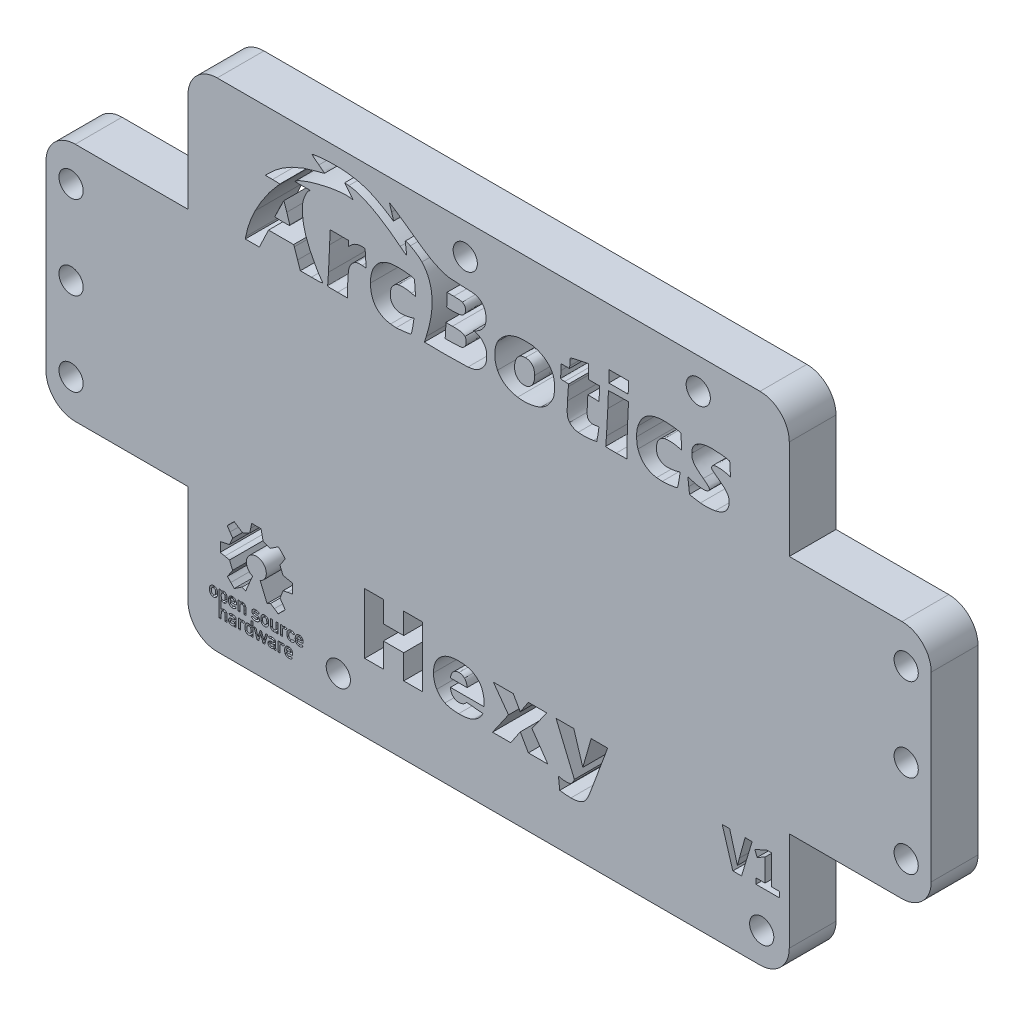
from build123d import *

# Parameters (mm, degrees)
MODEL_R                = 1.45
BOSS_EXTRUDE1_DEPTH    = 5.6
BOSS_EXTRUDE1_2_DEPTH  = 5.6
BOSS_EXTRUDE1_3_DEPTH  = 5.6
BOSS_EXTRUDE1_4_DEPTH  = 5.6
BOSS_EXTRUDE1_5_DEPTH  = 5.6
BOSS_EXTRUDE1_6_DEPTH  = 5.6
BOSS_EXTRUDE1_7_DEPTH  = 5.6
BOSS_EXTRUDE1_8_DEPTH  = 5.6
BOSS_EXTRUDE1_9_DEPTH  = 5.6
BOSS_EXTRUDE1_10_DEPTH = 5.6
BOSS_EXTRUDE1_11_DEPTH = 5.6
BOSS_EXTRUDE1_12_DEPTH = 5.6
BOSS_EXTRUDE1_13_DEPTH = 5.6
BOSS_EXTRUDE1_14_DEPTH = 5.6
BOSS_EXTRUDE1_15_DEPTH = 5.6
CUT_EXTRUDE1_DEPTH     = 5.6
FILLET1_R              = 3.5


with BuildPart() as part:
    # Model → Boss-Extrude1 (new body)
    with BuildSketch(Plane.XY):
        Polygon((653.4922175, 464.272333), (636.4922175, 464.272333), (636.4922175, 479.647333), (564.4922175, 479.647333), (564.4922175, 464.272333), (547.4922175, 464.272333), (547.4922175, 435.522333), (564.4922175, 435.522333), (564.4922175, 420.147333), (636.4922175, 420.147333), (636.4922175, 435.522333), (653.4922175, 435.522333), align=None)
        with BuildLine():
            Line((570.050639, 423.880087), (570.001778, 423.832728))
            add(Edge.make_bspline(
                [(569.902379, 423.770876), (569.930174, 423.778848), (569.974904, 423.806682), (570.001778, 423.832728)],
                knots=[0, 0, 0, 0, 1, 1, 1, 1], degree=3))
            add(Edge.make_bspline(
                [(569.589312, 423.777642), (569.65536, 423.754083), (569.830615, 423.750295), (569.902379, 423.770876)],
                knots=[0, 0, 0, 0, 1, 1, 1, 1], degree=3))
            add(Edge.make_bspline(
                [(569.381774, 423.949909), (569.422474, 423.868234), (569.488133, 423.813734), (569.589312, 423.777642)],
                knots=[0, 0, 0, 0, 1, 1, 1, 1], degree=3))
            add(Edge.make_bspline(
                [(569.436111, 424.337761), (569.334442, 424.232148), (569.313965, 424.085984), (569.381774, 423.949909)],
                knots=[0, 0, 0, 0, 1, 1, 1, 1], degree=3))
            add(Edge.make_bspline(
                [(569.854322, 424.449169), (569.604094, 424.449169), (569.522411, 424.427409), (569.436111, 424.337761)],
                knots=[0, 0, 0, 0, 1, 1, 1, 1], degree=3))
            Line((569.854322, 424.449169), (570.050639, 424.449169))
            Line((570.050639, 424.449169), (570.050639, 424.535622))
            add(Edge.make_bspline(
                [(569.775102, 424.725832), (569.97499, 424.73866), (570.050639, 424.686437), (570.050639, 424.535622)],
                knots=[0, 0, 0, 0, 1, 1, 1, 1], degree=3))
            add(Edge.make_bspline(
                [(569.622945, 424.687172), (569.654611, 424.710584), (569.694183, 424.720638), (569.775102, 424.725832)],
                knots=[0, 0, 0, 0, 1, 1, 1, 1], degree=3))
            add(Edge.make_bspline(
                [(569.622945, 424.687172), (569.599406, 424.66977), (569.576278, 424.655531), (569.566819, 424.655531), (569.525879, 424.683519), (569.480572, 424.717726)],
                knots=[0, 0, 0, 0, 1, 1, 2.000211461, 2.000211461, 2.000211461, 2.000211461], degree=3))
            Line((569.480572, 424.717726), (569.398195, 424.779922))
            Line((569.398195, 424.779922), (569.459637, 424.834447))
            add(Edge.make_bspline(
                [(569.459637, 424.834447), (569.545558, 424.910696), (569.629425, 424.935594), (570.038572, 424.935594), (570.17261, 424.875194), (570.235864, 424.739338)],
                knots=[0, 0, 0, 0, 1, 1, 2.393876452, 2.393876452, 2.393876452, 2.393876452], degree=3))
            add(Edge.make_bspline(
                [(570.271597, 424.217012), (570.271455, 424.657333), (570.271008, 424.663856), (570.235864, 424.739338)],
                knots=[0, 0, 0, 0, 1, 1, 1, 1], degree=3))
            Line((570.271597, 424.217012), (570.271741, 423.771123))
            Line((570.271741, 423.771123), (570.050639, 423.771123))
            Line((570.050639, 423.771123), (570.050639, 423.880087))
        make_face(mode=Mode.SUBTRACT)
        with BuildLine():
            Line((568.237601, 423.771123), (568.237601, 426.778112))
            Line((568.237601, 426.778112), (568.473443, 426.778112))
            Line((568.473443, 426.778112), (568.473443, 426.662184))
            Line((568.473443, 426.662184), (568.54791, 426.712297))
            add(Edge.make_bspline(
                [(568.895191, 426.771074), (568.76352, 426.810176), (568.669783, 426.794311), (568.54791, 426.712297)],
                knots=[0, 0, 0, 0, 1, 1, 1, 1], degree=3))
            add(Edge.make_bspline(
                [(569.124399, 426.575395), (569.080274, 426.664994), (568.988462, 426.743375), (568.895191, 426.771074)],
                knots=[0, 0, 0, 0, 1, 1, 1, 1], degree=3))
            add(Edge.make_bspline(
                [(569.124399, 426.575395), (569.157205, 426.50878), (569.15886, 426.490552), (569.15886, 425.901201), (569.157205, 425.882972), (569.124399, 425.816357)],
                knots=[0, 0, 0, 0, 1, 1, 1.999996606, 1.999996606, 1.999996606, 1.999996606], degree=3))
            add(Edge.make_bspline(
                [(569.124399, 425.816357), (569.062181, 425.690019), (568.91498, 425.5989), (568.708795, 425.5989), (568.593225, 425.643699), (568.526774, 425.694383)],
                knots=[0, 0, 0, 0, 1, 1, 1.453224886, 1.453224886, 1.453224886, 1.453224886], degree=3))
            Line((568.526774, 425.694383), (568.473443, 425.735061))
            Line((568.473443, 425.735061), (568.473443, 424.80434))
            Line((568.473443, 424.80434), (568.513979, 424.842485))
            add(Edge.make_bspline(
                [(568.513979, 424.842485), (568.582306, 424.906781), (568.662004, 424.934947), (568.935759, 424.934947), (569.05027, 424.865735), (569.126877, 424.722642)],
                knots=[0, 0, 0, 0, 1, 1, 2.40956061, 2.40956061, 2.40956061, 2.40956061], degree=3))
            add(Edge.make_bspline(
                [(569.163342, 424.217012), (569.159072, 424.641785), (569.157345, 424.66573), (569.126877, 424.722642)],
                knots=[0, 0, 0, 0, 1, 1, 1, 1], degree=3))
            Line((569.163342, 424.217012), (569.167824, 423.771123))
            Line((569.167824, 423.771123), (568.946913, 423.771123))
            Line((568.946913, 423.771123), (568.942335, 424.158051))
            add(Edge.make_bspline(
                [(568.908278, 424.59503), (568.935377, 424.549023), (568.938128, 424.513726), (568.942335, 424.158051)],
                knots=[0, 0, 0, 0, 1, 1, 1, 1], degree=3))
            add(Edge.make_bspline(
                [(568.908278, 424.59503), (568.858649, 424.679286), (568.80805, 424.707122), (568.633944, 424.707122), (568.603113, 424.699731), (568.567387, 424.674247)],
                knots=[0, 0, 0, 0, 1, 1, 1.681696127, 1.681696127, 1.681696127, 1.681696127], degree=3))
            add(Edge.make_bspline(
                [(568.473443, 424.155824), (568.473443, 424.581905), (568.478715, 424.610997), (568.567387, 424.674247)],
                knots=[0, 0, 0, 0, 1, 1, 1, 1], degree=3))
            Line((568.473443, 424.155824), (568.473443, 423.771123))
            Line((568.473443, 423.771123), (568.237601, 423.771123))
        make_face(mode=Mode.SUBTRACT)
        with BuildLine():
            Line((570.537063, 423.771123), (570.537063, 424.935594))
            Line((570.537063, 424.935594), (570.772906, 424.935594))
            Line((570.772906, 424.935594), (570.772906, 424.799879))
            Line((570.772906, 424.799879), (570.827109, 424.84747))
            add(Edge.make_bspline(
                [(570.827109, 424.84747), (570.902921, 424.914034), (570.963303, 424.935594), (571.166405, 424.935594), (571.215662, 424.92244), (571.285057, 424.87921)],
                knots=[0, 0, 0, 0, 1, 1, 1.836215859, 1.836215859, 1.836215859, 1.836215859], degree=3))
            Line((571.285057, 424.87921), (571.318154, 424.858592))
            Line((571.318154, 424.858592), (571.274748, 424.804967))
            add(Edge.make_bspline(
                [(571.19592, 424.708096), (571.215402, 424.731881), (571.250875, 424.775474), (571.274748, 424.804967)],
                knots=[0, 0, 0, 0, 1, 1, 1, 1], degree=3))
            Line((571.19592, 424.708096), (571.160497, 424.664849))
            Line((571.160497, 424.664849), (571.104658, 424.691346))
            add(Edge.make_bspline(
                [(570.863934, 424.674967), (570.920602, 424.716496), (571.035225, 424.724295), (571.104658, 424.691346)],
                knots=[0, 0, 0, 0, 1, 1, 1, 1], degree=3))
            add(Edge.make_bspline(
                [(570.772929, 424.158051), (570.772954, 424.581871), (570.778294, 424.612207), (570.863934, 424.674967)],
                knots=[0, 0, 0, 0, 1, 1, 1, 1], degree=3))
            Line((570.772929, 424.158051), (570.772906, 423.771123))
            Line((570.772906, 423.771123), (570.537063, 423.771123))
        make_face(mode=Mode.SUBTRACT)
        with BuildLine():
            Line((572.040558, 423.892543), (571.989061, 423.853264))
            add(Edge.make_bspline(
                [(571.57528, 423.784247), (571.6983, 423.728372), (571.86087, 423.755488), (571.989061, 423.853264)],
                knots=[0, 0, 0, 0, 1, 1, 1, 1], degree=3))
            add(Edge.make_bspline(
                [(571.375892, 423.981062), (571.41432, 423.894902), (571.484778, 423.825353), (571.57528, 423.784247)],
                knots=[0, 0, 0, 0, 1, 1, 1, 1], degree=3))
            add(Edge.make_bspline(
                [(571.340916, 424.338618), (571.341302, 424.077176), (571.343628, 424.053403), (571.375892, 423.981062)],
                knots=[0, 0, 0, 0, 1, 1, 1, 1], degree=3))
            add(Edge.make_bspline(
                [(571.436392, 424.807008), (571.350372, 424.709285), (571.34044, 424.660561), (571.340916, 424.338618)],
                knots=[0, 0, 0, 0, 1, 1, 1, 1], degree=3))
            add(Edge.make_bspline(
                [(571.436392, 424.807008), (571.517926, 424.899636), (571.597659, 424.935594), (571.825913, 424.935594), (571.895157, 424.910135), (571.992653, 424.835907)],
                knots=[0, 0, 0, 0, 1, 1, 1.842883325, 1.842883325, 1.842883325, 1.842883325], degree=3))
            Line((571.992653, 424.835907), (572.040558, 424.799434))
            Line((572.040558, 424.799434), (572.040558, 425.407279))
            Line((572.040558, 425.407279), (572.26166, 425.407279))
            Line((572.26166, 425.407279), (572.26166, 423.771123))
            Line((572.26166, 423.771123), (572.040558, 423.771123))
            Line((572.040558, 423.771123), (572.040558, 423.892543))
        make_face(mode=Mode.SUBTRACT)
        with BuildLine():
            Line((573.21977, 424.581816), (573.093046, 424.180148))
            Line((573.093046, 424.180148), (572.973692, 423.778483))
            Line((572.973692, 423.778483), (572.76845, 423.769935))
            Line((572.76845, 423.769935), (572.61588, 424.245894))
            add(Edge.make_bspline(
                [(572.429778, 424.829308), (572.448221, 424.770213), (572.531967, 424.50768), (572.61588, 424.245894)],
                knots=[0, 0, 0, 0, 1, 1, 1, 1], degree=3))
            Line((572.429778, 424.829308), (572.396246, 424.936755))
            Line((572.396246, 424.936755), (572.516668, 424.932489))
            Line((572.516668, 424.932489), (572.63709, 424.928224))
            Line((572.63709, 424.928224), (572.747863, 424.527415))
            add(Edge.make_bspline(
                [(572.866472, 424.119138), (572.862162, 424.123245), (572.808788, 424.30697), (572.747863, 424.527415)],
                knots=[0, 0, 0, 0, 1, 1, 1, 1], degree=3))
            add(Edge.make_bspline(
                [(573.006503, 424.52348), (572.933795, 424.296985), (572.870781, 424.115032), (572.866472, 424.119138)],
                knots=[0, 0, 0, 0, 1, 1, 1, 1], degree=3))
            Line((573.006503, 424.52348), (573.138699, 424.93529))
            Line((573.138699, 424.93529), (573.21977, 424.935378))
            Line((573.21977, 424.935378), (573.30084, 424.935466))
            Line((573.30084, 424.935466), (573.43346, 424.522802))
            add(Edge.make_bspline(
                [(573.573491, 424.110196), (573.569414, 424.110163), (573.5064, 424.295836), (573.43346, 424.522802)],
                knots=[0, 0, 0, 0, 1, 1, 1, 1], degree=3))
            add(Edge.make_bspline(
                [(573.573491, 424.110196), (573.577568, 424.110226), (573.630362, 424.293372), (573.75126, 424.740988), (573.808262, 424.926999), (573.817481, 424.930537)],
                knots=[0, 0, 0, 0, 1, 1, 2, 2, 2, 2], degree=3))
            add(Edge.make_bspline(
                [(573.938392, 424.932592), (573.881111, 424.934999), (573.826701, 424.934074), (573.817481, 424.930537)],
                knots=[0, 0, 0, 0, 1, 1, 1, 1], degree=3))
            Line((573.938392, 424.932592), (574.041983, 424.928214))
            Line((574.041983, 424.928214), (573.881001, 424.42705))
            add(Edge.make_bspline(
                [(573.696862, 423.847878), (573.709599, 423.890782), (573.792461, 424.151409), (573.881001, 424.42705)],
                knots=[0, 0, 0, 0, 1, 1, 1, 1], degree=3))
            Line((573.696862, 423.847878), (573.673705, 423.769871))
            Line((573.673705, 423.769871), (573.465761, 423.778483))
            Line((573.465761, 423.778483), (573.346728, 424.180152))
            Line((573.346728, 424.180152), (573.21977, 424.581816))
        make_face(mode=Mode.SUBTRACT)
        with BuildLine():
            add(Edge.make_bspline(
                [(567.419523, 425.619519), (567.605599, 425.560671), (567.824121, 425.633717), (567.938622, 425.79304)],
                knots=[0, 0, 0, 0, 1, 1, 1, 1], degree=3))
            add(Edge.make_bspline(
                [(567.200261, 425.762108), (567.271638, 425.682721), (567.320826, 425.650733), (567.419523, 425.619519)],
                knots=[0, 0, 0, 0, 1, 1, 1, 1], degree=3))
            add(Edge.make_bspline(
                [(567.200261, 425.762108), (567.104452, 425.868672), (567.081237, 425.953274), (567.081237, 426.442996), (567.10421, 426.524129), (567.205592, 426.635057)],
                knots=[0, 0, 0, 0, 1, 1, 2.018623095, 2.018623095, 2.018623095, 2.018623095], degree=3))
            add(Edge.make_bspline(
                [(567.552184, 426.784608), (567.396519, 426.783454), (567.305211, 426.744055), (567.205592, 426.635057)],
                knots=[0, 0, 0, 0, 1, 1, 1, 1], degree=3))
            add(Edge.make_bspline(
                [(567.835513, 426.701336), (567.734766, 426.76931), (567.679505, 426.785551), (567.552184, 426.784608)],
                knots=[0, 0, 0, 0, 1, 1, 1, 1], degree=3))
            add(Edge.make_bspline(
                [(567.835513, 426.701336), (567.974184, 426.607774), (568.031239, 426.460431), (568.031239, 426.000638), (568.004625, 425.884878), (567.938622, 425.79304)],
                knots=[0, 0, 0, 0, 1, 1, 1.73798643, 1.73798643, 1.73798643, 1.73798643], degree=3))
        make_face(mode=Mode.SUBTRACT)
        with BuildLine():
            Line((569.564214, 426.114805), (569.564214, 426.065533))
            add(Edge.make_bspline(
                [(569.690611, 425.85341), (569.623501, 425.8916), (569.564214, 425.991097), (569.564214, 426.065533)],
                knots=[0, 0, 0, 0, 1, 1, 1, 1], degree=3))
            add(Edge.make_bspline(
                [(570.080813, 425.901701), (569.989325, 425.818906), (569.793774, 425.794705), (569.690611, 425.85341)],
                knots=[0, 0, 0, 0, 1, 1, 1, 1], degree=3))
            add(Edge.make_bspline(
                [(570.179731, 425.860355), (570.113069, 425.915445), (570.101393, 425.920326), (570.080813, 425.901701)],
                knots=[0, 0, 0, 0, 1, 1, 1, 1], degree=3))
            add(Edge.make_bspline(
                [(570.256158, 425.787434), (570.255694, 425.793186), (570.221302, 425.826001), (570.179731, 425.860355)],
                knots=[0, 0, 0, 0, 1, 1, 1, 1], degree=3))
            add(Edge.make_bspline(
                [(570.084448, 425.655208), (570.170214, 425.696219), (570.258058, 425.763863), (570.256158, 425.787434)],
                knots=[0, 0, 0, 0, 1, 1, 1, 1], degree=3))
            add(Edge.make_bspline(
                [(569.716682, 425.613321), (569.829147, 425.589362), (569.983513, 425.606944), (570.084448, 425.655208)],
                knots=[0, 0, 0, 0, 1, 1, 1, 1], degree=3))
            add(Edge.make_bspline(
                [(569.344378, 426.309907), (569.298463, 425.94269), (569.443384, 425.671541), (569.716682, 425.613321)],
                knots=[0, 0, 0, 0, 1, 1, 1, 1], degree=3))
            add(Edge.make_bspline(
                [(569.815106, 426.785177), (569.554167, 426.784459), (569.381976, 426.610607), (569.344378, 426.309907)],
                knots=[0, 0, 0, 0, 1, 1, 1, 1], degree=3))
            add(Edge.make_bspline(
                [(570.024535, 426.736957), (569.939245, 426.778946), (569.911034, 426.785441), (569.815106, 426.785177)],
                knots=[0, 0, 0, 0, 1, 1, 1, 1], degree=3))
            add(Edge.make_bspline(
                [(570.286481, 426.261654), (570.286481, 426.509179), (570.211741, 426.644796), (570.024535, 426.736957)],
                knots=[0, 0, 0, 0, 1, 1, 1, 1], degree=3))
            Line((570.286481, 426.261654), (570.286481, 426.114805))
            Line((570.286481, 426.114805), (569.564214, 426.114805))
        make_face(mode=Mode.SUBTRACT)
        with BuildLine():
            Line((570.507583, 425.613641), (570.507583, 426.778112))
            Line((570.507583, 426.778112), (570.728685, 426.778112))
            Line((570.728685, 426.778112), (570.728685, 426.639668))
            Line((570.728685, 426.639668), (570.776591, 426.685129))
            add(Edge.make_bspline(
                [(571.386483, 426.565199), (571.276115, 426.802218), (570.964536, 426.863487), (570.776591, 426.685129)],
                knots=[0, 0, 0, 0, 1, 1, 1, 1], degree=3))
            add(Edge.make_bspline(
                [(571.421328, 426.05216), (571.421187, 426.481589), (571.420465, 426.492224), (571.386483, 426.565199)],
                knots=[0, 0, 0, 0, 1, 1, 1, 1], degree=3))
            Line((571.421328, 426.05216), (571.421472, 425.613641))
            Line((571.421472, 425.613641), (571.20037, 425.613641))
            Line((571.20037, 425.613641), (571.200046, 425.993199))
            add(Edge.make_bspline(
                [(571.171422, 426.435099), (571.19695, 426.378863), (571.199754, 426.335585), (571.200046, 425.993199)],
                knots=[0, 0, 0, 0, 1, 1, 1, 1], degree=3))
            add(Edge.make_bspline(
                [(571.171422, 426.435099), (571.133455, 426.518738), (571.068632, 426.556899), (570.860422, 426.556899), (570.7956, 426.518738), (570.757632, 426.435099)],
                knots=[0, 0, 0, 0, 1, 1, 2, 2, 2, 2], degree=3))
            add(Edge.make_bspline(
                [(570.729008, 425.993199), (570.7293, 426.335585), (570.732104, 426.378863), (570.757632, 426.435099)],
                knots=[0, 0, 0, 0, 1, 1, 1, 1], degree=3))
            Line((570.729008, 425.993199), (570.728685, 425.613641))
            Line((570.728685, 425.613641), (570.507583, 425.613641))
        make_face(mode=Mode.SUBTRACT)
        with BuildLine():
            Line((572.893323, 426.472576), (572.809649, 426.518478))
            add(Edge.make_bspline(
                [(572.809649, 426.518478), (572.733174, 426.56043), (572.714348, 426.56438), (572.468146, 426.56438), (572.452234, 426.561097), (572.417657, 426.528645)],
                knots=[0, 0, 0, 0, 1, 1, 1.993619175, 1.993619175, 1.993619175, 1.993619175], degree=3))
            add(Edge.make_bspline(
                [(572.417657, 426.528645), (572.390122, 426.502803), (572.379581, 426.477932), (572.379581, 426.357066), (572.414492, 426.334737), (572.566951, 426.318963)],
                knots=[0, 0, 0, 0, 1, 1, 3.088989982, 3.088989982, 3.088989982, 3.088989982], degree=3))
            add(Edge.make_bspline(
                [(573.009271, 426.156784), (572.938856, 426.263187), (572.873139, 426.287283), (572.566951, 426.318963)],
                knots=[0, 0, 0, 0, 1, 1, 1, 1], degree=3))
            add(Edge.make_bspline(
                [(573.030411, 425.82444), (573.074186, 425.910245), (573.063739, 426.074477), (573.009271, 426.156784)],
                knots=[0, 0, 0, 0, 1, 1, 1, 1], degree=3))
            add(Edge.make_bspline(
                [(572.803301, 425.636802), (572.897497, 425.667864), (572.989173, 425.743606), (573.030411, 425.82444)],
                knots=[0, 0, 0, 0, 1, 1, 1, 1], degree=3))
            add(Edge.make_bspline(
                [(572.468022, 425.607846), (572.537559, 425.59504), (572.726011, 425.611315), (572.803301, 425.636802)],
                knots=[0, 0, 0, 0, 1, 1, 1, 1], degree=3))
            add(Edge.make_bspline(
                [(572.090243, 425.793605), (572.122391, 425.741589), (572.350289, 425.629528), (572.468022, 425.607846)],
                knots=[0, 0, 0, 0, 1, 1, 1, 1], degree=3))
            add(Edge.make_bspline(
                [(572.154619, 425.882122), (572.114141, 425.841644), (572.085172, 425.801811), (572.090243, 425.793605)],
                knots=[0, 0, 0, 0, 1, 1, 1, 1], degree=3))
            Line((572.154619, 425.882122), (572.228217, 425.95572))
            Line((572.228217, 425.95572), (572.290223, 425.910802))
            add(Edge.make_bspline(
                [(572.615425, 425.822236), (572.48029, 425.816099), (572.385212, 425.841993), (572.290223, 425.910802)],
                knots=[0, 0, 0, 0, 1, 1, 1, 1], degree=3))
            add(Edge.make_bspline(
                [(572.828316, 425.928374), (572.803093, 425.857552), (572.743964, 425.828073), (572.615425, 425.822236)],
                knots=[0, 0, 0, 0, 1, 1, 1, 1], degree=3))
            add(Edge.make_bspline(
                [(572.777222, 426.065381), (572.823449, 426.043887), (572.846982, 425.980783), (572.828316, 425.928374)],
                knots=[0, 0, 0, 0, 1, 1, 1, 1], degree=3))
            add(Edge.make_bspline(
                [(572.574019, 426.098276), (572.665702, 426.08952), (572.757143, 426.074718), (572.777222, 426.065381)],
                knots=[0, 0, 0, 0, 1, 1, 1, 1], degree=3))
            add(Edge.make_bspline(
                [(572.242205, 426.200124), (572.301299, 426.146686), (572.407073, 426.114219), (572.574019, 426.098276)],
                knots=[0, 0, 0, 0, 1, 1, 1, 1], degree=3))
            add(Edge.make_bspline(
                [(572.19151, 426.603413), (572.120782, 426.482725), (572.14529, 426.287766), (572.242205, 426.200124)],
                knots=[0, 0, 0, 0, 1, 1, 1, 1], degree=3))
            add(Edge.make_bspline(
                [(572.286523, 426.708452), (572.255609, 426.6871), (572.212853, 426.639832), (572.19151, 426.603413)],
                knots=[0, 0, 0, 0, 1, 1, 1, 1], degree=3))
            add(Edge.make_bspline(
                [(572.286523, 426.708452), (572.350603, 426.752711), (572.489689, 426.792852), (572.722, 426.792852), (572.901305, 426.736781), (572.99739, 426.662005)],
                knots=[0, 0, 0, 0, 1, 1, 2.602224612, 2.602224612, 2.602224612, 2.602224612], degree=3))
            Line((572.99739, 426.662005), (573.032964, 426.634321))
            Line((573.032964, 426.634321), (572.963143, 426.553448))
            Line((572.963143, 426.553448), (572.893323, 426.472576))
        make_face(mode=Mode.SUBTRACT)
        with BuildLine():
            Line((573.212399, 425.959414), (573.212632, 426.195566))
            add(Edge.make_bspline(
                [(573.304417, 426.606198), (573.220655, 426.484918), (573.212883, 426.450146), (573.212632, 426.195566)],
                knots=[0, 0, 0, 0, 1, 1, 1, 1], degree=3))
            add(Edge.make_bspline(
                [(573.88293, 426.747289), (573.675676, 426.836448), (573.420448, 426.774201), (573.304417, 426.606198)],
                knots=[0, 0, 0, 0, 1, 1, 1, 1], degree=3))
            add(Edge.make_bspline(
                [(574.127697, 426.482915), (574.091922, 426.585724), (573.981664, 426.704815), (573.88293, 426.747289)],
                knots=[0, 0, 0, 0, 1, 1, 1, 1], degree=3))
            add(Edge.make_bspline(
                [(574.121729, 425.893076), (574.166813, 426.007748), (574.17038, 426.36025), (574.127697, 426.482915)],
                knots=[0, 0, 0, 0, 1, 1, 1, 1], degree=3))
            add(Edge.make_bspline(
                [(573.707582, 425.604777), (573.893643, 425.61358), (574.056383, 425.726867), (574.121729, 425.893076)],
                knots=[0, 0, 0, 0, 1, 1, 1, 1], degree=3))
            add(Edge.make_bspline(
                [(573.566163, 425.611744), (573.590485, 425.605383), (573.654123, 425.602248), (573.707582, 425.604777)],
                knots=[0, 0, 0, 0, 1, 1, 1, 1], degree=3))
            add(Edge.make_bspline(
                [(573.26097, 425.860753), (573.324824, 425.731047), (573.426165, 425.648363), (573.566163, 425.611744)],
                knots=[0, 0, 0, 0, 1, 1, 1, 1], degree=3))
            Line((573.26097, 425.860753), (573.212399, 425.959414))
        make_face(mode=Mode.SUBTRACT)
        with BuildLine():
            add(Edge.make_bspline(
                [(569.477882528, 431.998521528), (569.459778528, 431.981237528), (569.293652528, 431.944731528), (568.921428528, 431.876243528)],
                knots=[0, 0, 0, 0, 1, 1, 1, 1], degree=3))
            Line((569.477882528, 431.998521528), (569.842687528, 432.838468528))
            add(Edge.make_bspline(
                [(569.524201528, 433.327515528), (569.699368528, 433.072525528), (569.842687528, 432.852454528), (569.842687528, 432.838468528)],
                knots=[0, 0, 0, 0, 1, 1, 1, 1], degree=3))
            add(Edge.make_bspline(
                [(569.197784528, 433.811010528), (569.202147528, 433.800077528), (569.349035528, 433.582504528), (569.524201528, 433.327515528)],
                knots=[0, 0, 0, 0, 1, 1, 1, 1], degree=3))
            add(Edge.make_bspline(
                [(569.197784528, 433.811010528), (569.189031528, 433.832943528), (569.999566528, 434.653430528), (570.039877528, 434.653430528), (570.260265528, 434.507503528), (570.519737528, 434.329147528)],
                knots=[0, 0, 0, 0, 1, 1, 1.325147929, 1.325147929, 1.325147929, 1.325147929], degree=3))
            add(Edge.make_bspline(
                [(571.033389528, 434.004864528), (571.002935528, 434.004864528), (570.862760528, 434.093361528), (570.519737528, 434.329147528)],
                knots=[0, 0, 0, 0, 1, 1, 1, 1], degree=3))
            Line((571.033389528, 434.004864528), (571.87694539, 434.370978))
            add(Edge.make_bspline(
                [(572.00265039, 434.943782), (571.93055239, 434.551176), (571.89533839, 434.390716), (571.87694539, 434.370978)],
                knots=[0, 0, 0, 0, 1, 1, 1, 1], degree=3))
            add(Edge.make_bspline(
                [(572.11511339, 435.522333), (572.10834439, 435.504092), (572.05773539, 435.243744), (572.00265039, 434.943782)],
                knots=[0, 0, 0, 0, 1, 1, 1, 1], degree=3))
            Line((572.11511339, 435.522333), (573.24592661, 435.522333))
            add(Edge.make_bspline(
                [(573.36375661, 434.937899), (573.30549161, 435.249204), (573.25246761, 435.512199), (573.24592661, 435.522333)],
                knots=[0, 0, 0, 0, 1, 1, 1, 1], degree=3))
            add(Edge.make_bspline(
                [(573.49004061, 434.351544), (573.47813261, 434.363452), (573.42575561, 434.606647), (573.36375661, 434.937899)],
                knots=[0, 0, 0, 0, 1, 1, 1, 1], degree=3))
            Line((573.49004061, 434.351544), (574.307726365, 434.030010811))
            add(Edge.make_bspline(
                [(574.812785365, 434.348948811), (574.488199365, 434.126370811), (574.335608365, 434.030010811), (574.307726365, 434.030010811)],
                knots=[0, 0, 0, 0, 1, 1, 1, 1], degree=3))
            add(Edge.make_bspline(
                [(575.306386365, 434.675337811), (575.290714365, 434.671239811), (575.068593365, 434.524363811), (574.812785365, 434.348948811)],
                knots=[0, 0, 0, 0, 1, 1, 1, 1], degree=3))
            add(Edge.make_bspline(
                [(575.738756365, 434.279114811), (575.426859365, 434.590856811), (575.328391365, 434.681091811), (575.306386365, 434.675337811)],
                knots=[0, 0, 0, 0, 1, 1, 1, 1], degree=3))
            add(Edge.make_bspline(
                [(575.738756365, 434.279114811), (575.960887365, 434.057093811), (576.142630365, 433.865073811), (576.142630365, 433.839732811), (576.000182365, 433.621559811), (575.826079365, 433.367574811)],
                knots=[0, 0, 0, 0, 1, 1, 1.99992108, 1.99992108, 1.99992108, 1.99992108], degree=3))
            add(Edge.make_bspline(
                [(575.501031365, 432.879010811), (575.505705365, 432.893736811), (575.651977365, 433.113589811), (575.826079365, 433.367574811)],
                knots=[0, 0, 0, 0, 1, 1, 1, 1], degree=3))
            Line((575.501031365, 432.879010811), (575.869862472, 432.002561528))
            add(Edge.make_bspline(
                [(576.439612472, 431.878467528), (576.059454472, 431.948157528), (575.886845472, 431.985752528), (575.869862472, 432.002561528)],
                knots=[0, 0, 0, 0, 1, 1, 1, 1], degree=3))
            add(Edge.make_bspline(
                [(577.003422472, 431.764430528), (576.993289472, 431.772162528), (576.739574472, 431.823479528), (576.439612472, 431.878467528)],
                knots=[0, 0, 0, 0, 1, 1, 1, 1], degree=3))
            Line((577.003422472, 431.764430528), (577.003422472, 430.634430528))
            add(Edge.make_bspline(
                [(576.421324044, 430.517052972), (576.731911501, 430.57566632), (576.993855163, 430.628486481), (577.003422472, 430.634430528)],
                knots=[0, 0, 0, 0, 1, 1, 1, 1], degree=3))
            add(Edge.make_bspline(
                [(575.864035044, 430.397466972), (575.874388044, 430.408065972), (576.125168044, 430.461879972), (576.421324044, 430.517052972)],
                knots=[0, 0, 0, 0, 1, 1, 1, 1], degree=3))
            Line((575.864035044, 430.397466972), (575.521838337, 429.46971194))
            add(Edge.make_bspline(
                [(575.833030337, 429.00638694), (575.669820337, 429.24383994), (575.529784337, 429.45233694), (575.521838337, 429.46971194)],
                knots=[0, 0, 0, 0, 1, 1, 1, 1], degree=3))
            add(Edge.make_bspline(
                [(575.833030337, 429.00638694), (575.996241337, 428.76893294), (576.129776337, 428.56658094), (576.129776337, 428.52635694), (575.309272337, 427.71581494), (575.287356337, 427.72452194)],
                knots=[0, 0, 0, 0, 1, 1, 4.076619033, 4.076619033, 4.076619033, 4.076619033], degree=3))
            add(Edge.make_bspline(
                [(575.287356337, 427.72452194), (575.276423337, 427.72886494), (575.073453337, 427.86580294), (574.599169337, 428.19185494), (574.391418337, 428.32523994), (574.374643337, 428.32523994)],
                knots=[0, 0, 0, 0, 1, 1, 2, 2, 2, 2], degree=3))
            Line((574.374643337, 428.32523994), (573.965252119, 428.125639748))
            Line((573.965252119, 428.125639748), (573.134729992, 430.096843246))
            ThreePointArc((573.134729992, 430.096843246), (572.68052, 432.39190922), (572.226310008, 430.096843246))
            Line((572.226310008, 430.096843246), (571.395787881, 428.125639748))
            Line((571.395787881, 428.125639748), (570.972257528, 428.332133528))
            add(Edge.make_bspline(
                [(570.972257528, 428.332133528), (570.956645528, 428.332133528), (570.745531528, 428.196155528), (570.260701528, 427.863765528), (570.055640528, 427.727787528), (570.039211528, 427.727787528), (569.847506528, 427.912859528), (569.621415528, 428.139058528)],
                knots=[0, 0, 0, 0, 1, 1, 2, 2, 2.999878271, 2.999878271, 2.999878271, 2.999878271], degree=3))
            add(Edge.make_bspline(
                [(569.218719528, 428.572165528), (569.213088528, 428.557488528), (569.345114528, 428.415492528), (569.621415528, 428.139058528)],
                knots=[0, 0, 0, 0, 1, 1, 1, 1], degree=3))
            add(Edge.make_bspline(
                [(569.218719528, 428.572165528), (569.223328528, 428.584174528), (569.363583528, 428.793009528), (569.697211528, 429.279475528), (569.833695528, 429.489183528), (569.833695528, 429.502259528)],
                knots=[0, 0, 0, 0, 1, 1, 2, 2, 2, 2], degree=3))
            Line((569.833695528, 429.502259528), (569.471601528, 430.396551528))
            add(Edge.make_bspline(
                [(568.910350528, 430.514460528), (569.207629528, 430.459078528), (569.460192528, 430.406019528), (569.471601528, 430.396551528)],
                knots=[0, 0, 0, 0, 1, 1, 1, 1], degree=3))
            add(Edge.make_bspline(
                [(568.357617528, 430.634430528), (568.365121528, 430.622598528), (568.578574528, 430.576269528), (568.910350528, 430.514460528)],
                knots=[0, 0, 0, 0, 1, 1, 1, 1], degree=3))
            Line((568.357617528, 430.634430528), (568.357617528, 431.764430528))
            add(Edge.make_bspline(
                [(568.921428528, 431.876243528), (568.629573528, 431.822542528), (568.375858528, 431.772226528), (568.357617528, 431.764430528)],
                knots=[0, 0, 0, 0, 1, 1, 1, 1], degree=3))
        make_face(mode=Mode.SUBTRACT)
        with BuildLine():
            Line((574.782225, 423.879819), (574.741689, 423.840993))
            add(Edge.make_bspline(
                [(574.646352, 423.779275), (574.676493, 423.791865), (574.719395, 423.819639), (574.741689, 423.840993)],
                knots=[0, 0, 0, 0, 1, 1, 1, 1], degree=3))
            add(Edge.make_bspline(
                [(574.320898, 423.777642), (574.39829, 423.750036), (574.578521, 423.75094), (574.646352, 423.779275)],
                knots=[0, 0, 0, 0, 1, 1, 1, 1], degree=3))
            add(Edge.make_bspline(
                [(574.074842, 424.106934), (574.075129, 423.95146), (574.162896, 423.834003), (574.320898, 423.777642)],
                knots=[0, 0, 0, 0, 1, 1, 1, 1], degree=3))
            add(Edge.make_bspline(
                [(574.25895, 424.409776), (574.137355, 424.344591), (574.074593, 424.241354), (574.074842, 424.106934)],
                knots=[0, 0, 0, 0, 1, 1, 1, 1], degree=3))
            add(Edge.make_bspline(
                [(574.5517, 424.446601), (574.346894, 424.442031), (574.310601, 424.437466), (574.25895, 424.409776)],
                knots=[0, 0, 0, 0, 1, 1, 1, 1], degree=3))
            Line((574.5517, 424.446601), (574.78549, 424.451818))
            Line((574.78549, 424.451818), (574.779527, 424.54547))
            add(Edge.make_bspline(
                [(574.746204, 424.669354), (574.76494, 424.648652), (574.775444, 424.609602), (574.779527, 424.54547)],
                knots=[0, 0, 0, 0, 1, 1, 1, 1], degree=3))
            add(Edge.make_bspline(
                [(574.327876, 424.666046), (574.396936, 424.749322), (574.671867, 424.751496), (574.746204, 424.669354)],
                knots=[0, 0, 0, 0, 1, 1, 1, 1], degree=3))
            add(Edge.make_bspline(
                [(574.219453, 424.711557), (574.298896, 424.649864), (574.310438, 424.645019), (574.327876, 424.666046)],
                knots=[0, 0, 0, 0, 1, 1, 1, 1], degree=3))
            Line((574.219453, 424.711557), (574.130545, 424.7806))
            Line((574.130545, 424.7806), (574.191959, 424.8351))
            add(Edge.make_bspline(
                [(574.567011, 424.933442), (574.369432, 424.939714), (574.284853, 424.917536), (574.191959, 424.8351)],
                knots=[0, 0, 0, 0, 1, 1, 1, 1], degree=3))
            add(Edge.make_bspline(
                [(574.819671, 424.883755), (574.741212, 424.92388), (574.716766, 424.928688), (574.567011, 424.933442)],
                knots=[0, 0, 0, 0, 1, 1, 1, 1], degree=3))
            add(Edge.make_bspline(
                [(574.951245, 424.767051), (574.917045, 424.82234), (574.886114, 424.849774), (574.819671, 424.883755)],
                knots=[0, 0, 0, 0, 1, 1, 1, 1], degree=3))
            Line((574.951245, 424.767051), (574.995957, 424.694771))
            Line((574.995957, 424.694771), (575.004879, 423.771123))
            Line((575.004879, 423.771123), (574.782225, 423.771123))
            Line((574.782225, 423.771123), (574.782225, 423.879819))
        make_face(mode=Mode.SUBTRACT)
        with BuildLine():
            Line((575.268649, 423.771123), (575.268649, 424.935594))
            Line((575.268649, 424.935594), (575.504492, 424.935594))
            Line((575.504492, 424.935594), (575.504492, 424.79715))
            Line((575.504492, 424.79715), (575.552397, 424.843514))
            add(Edge.make_bspline(
                [(575.552397, 424.843514), (575.619729, 424.908681), (575.69405, 424.935594), (575.881121, 424.935594), (575.920525, 424.926944), (575.977417, 424.898115)],
                knots=[0, 0, 0, 0, 1, 1, 1.660919285, 1.660919285, 1.660919285, 1.660919285], degree=3))
            Line((575.977417, 424.898115), (576.051378, 424.860636))
            Line((576.051378, 424.860636), (575.975215, 424.769139))
            add(Edge.make_bspline(
                [(575.975215, 424.769139), (575.933326, 424.718815), (575.893639, 424.67558), (575.880407, 424.670542), (575.854974, 424.678833), (575.830506, 424.691486)],
                knots=[0, 0, 0, 0, 1, 1, 2, 2, 2, 2], degree=3))
            add(Edge.make_bspline(
                [(575.537951, 424.612816), (575.599982, 424.70567), (575.733596, 424.7416), (575.830506, 424.691486)],
                knots=[0, 0, 0, 0, 1, 1, 1, 1], degree=3))
            add(Edge.make_bspline(
                [(575.504492, 424.166927), (575.504492, 424.553883), (575.50524, 424.56385), (575.537951, 424.612816)],
                knots=[0, 0, 0, 0, 1, 1, 1, 1], degree=3))
            Line((575.504492, 424.166927), (575.504492, 423.771123))
            Line((575.504492, 423.771123), (575.268649, 423.771123))
        make_face(mode=Mode.SUBTRACT)
        with BuildLine():
            Line((576.993878, 423.937265), (576.933417, 423.882643))
            add(Edge.make_bspline(
                [(576.602632, 423.76171), (576.756269, 423.76752), (576.839787, 423.798053), (576.933417, 423.882643)],
                knots=[0, 0, 0, 0, 1, 1, 1, 1], degree=3))
            add(Edge.make_bspline(
                [(576.411011, 423.776171), (576.448159, 423.7639), (576.519048, 423.75855), (576.602632, 423.76171)],
                knots=[0, 0, 0, 0, 1, 1, 1, 1], degree=3))
            add(Edge.make_bspline(
                [(576.132571, 424.002549), (576.184333, 423.899669), (576.285057, 423.817779), (576.411011, 423.776171)],
                knots=[0, 0, 0, 0, 1, 1, 1, 1], degree=3))
            add(Edge.make_bspline(
                [(576.086882, 424.549129), (576.046626, 424.37838), (576.067177, 424.132524), (576.132571, 424.002549)],
                knots=[0, 0, 0, 0, 1, 1, 1, 1], degree=3))
            add(Edge.make_bspline(
                [(576.355889, 424.902397), (576.212143, 424.836588), (576.128874, 424.727237), (576.086882, 424.549129)],
                knots=[0, 0, 0, 0, 1, 1, 1, 1], degree=3))
            add(Edge.make_bspline(
                [(576.563526, 424.932599), (576.450852, 424.93831), (576.426639, 424.934788), (576.355889, 424.902397)],
                knots=[0, 0, 0, 0, 1, 1, 1, 1], degree=3))
            add(Edge.make_bspline(
                [(577.022726, 424.379742), (577.022726, 424.725399), (576.863245, 424.917408), (576.563526, 424.932599)],
                knots=[0, 0, 0, 0, 1, 1, 1, 1], degree=3))
            Line((577.022726, 424.379742), (577.022726, 424.257547))
            Line((577.022726, 424.257547), (576.287573, 424.257547))
            Line((576.287573, 424.257547), (576.29593, 424.202272))
            add(Edge.make_bspline(
                [(576.77312, 424.031471), (576.569844, 423.896949), (576.329062, 423.983132), (576.29593, 424.202272)],
                knots=[0, 0, 0, 0, 1, 1, 1, 1], degree=3))
            add(Edge.make_bspline(
                [(576.932329, 423.99054), (576.838559, 424.071706), (576.835217, 424.072565), (576.77312, 424.031471)],
                knots=[0, 0, 0, 0, 1, 1, 1, 1], degree=3))
            Line((576.932329, 423.99054), (576.993878, 423.937265))
        make_face(mode=Mode.SUBTRACT)
        with BuildLine():
            Line((575.062287, 425.732951), (575.005365, 425.687207))
            add(Edge.make_bspline(
                [(574.654939, 425.614953), (574.769217, 425.581833), (574.910488, 425.610961), (575.005365, 425.687207)],
                knots=[0, 0, 0, 0, 1, 1, 1, 1], degree=3))
            add(Edge.make_bspline(
                [(574.422331, 425.805262), (574.469996, 425.72026), (574.567864, 425.64019), (574.654939, 425.614953)],
                knots=[0, 0, 0, 0, 1, 1, 1, 1], degree=3))
            Line((574.422331, 425.805262), (574.376871, 425.886333))
            Line((574.376871, 425.886333), (574.372389, 426.332222))
            Line((574.372389, 426.332222), (574.367907, 426.778112))
            Line((574.367907, 426.778112), (574.590603, 426.778112))
            Line((574.590603, 426.778112), (574.590603, 426.432444))
            add(Edge.make_bspline(
                [(574.673251, 425.892174), (574.600684, 425.962509), (574.590603, 426.028411), (574.590603, 426.432444)],
                knots=[0, 0, 0, 0, 1, 1, 1, 1], degree=3))
            add(Edge.make_bspline(
                [(574.673251, 425.892174), (574.722479, 425.844461), (574.729992, 425.842113), (574.928884, 425.842113), (574.946754, 425.846563), (574.98143, 425.878963)],
                knots=[0, 0, 0, 0, 1, 1, 1.922516287, 1.922516287, 1.922516287, 1.922516287], degree=3))
            add(Edge.make_bspline(
                [(575.062287, 426.386766), (575.062287, 425.964948), (575.060336, 425.952691), (574.98143, 425.878963)],
                knots=[0, 0, 0, 0, 1, 1, 1, 1], degree=3))
            Line((575.062287, 426.386766), (575.062287, 426.778112))
            Line((575.062287, 426.778112), (575.29813, 426.778112))
            Line((575.29813, 426.778112), (575.29813, 425.613641))
            Line((575.29813, 425.613641), (575.062287, 425.613641))
            Line((575.062287, 425.613641), (575.062287, 425.732951))
        make_face(mode=Mode.SUBTRACT)
        with BuildLine():
            Line((577.259764, 425.795032), (577.19829, 425.739494))
            add(Edge.make_bspline(
                [(576.699643, 425.621378), (576.869043, 425.573846), (577.066783, 425.620685), (577.19829, 425.739494)],
                knots=[0, 0, 0, 0, 1, 1, 1, 1], degree=3))
            add(Edge.make_bspline(
                [(576.379738, 425.900626), (576.446075, 425.755362), (576.552159, 425.66276), (576.699643, 425.621378)],
                knots=[0, 0, 0, 0, 1, 1, 1, 1], degree=3))
            add(Edge.make_bspline(
                [(576.391692, 426.51794), (576.313496, 426.363786), (576.307586, 426.058623), (576.379738, 425.900626)],
                knots=[0, 0, 0, 0, 1, 1, 1, 1], degree=3))
            add(Edge.make_bspline(
                [(576.628465, 426.742499), (576.529357, 426.697211), (576.439308, 426.611807), (576.391692, 426.51794)],
                knots=[0, 0, 0, 0, 1, 1, 1, 1], degree=3))
            add(Edge.make_bspline(
                [(576.845845, 426.784711), (576.739552, 426.784599), (576.70659, 426.778198), (576.628465, 426.742499)],
                knots=[0, 0, 0, 0, 1, 1, 1, 1], degree=3))
            add(Edge.make_bspline(
                [(577.19829, 426.652258), (577.094039, 426.746442), (576.991799, 426.784866), (576.845845, 426.784711)],
                knots=[0, 0, 0, 0, 1, 1, 1, 1], degree=3))
            Line((577.19829, 426.652258), (577.259764, 426.59672))
            Line((577.259764, 426.59672), (577.218631, 426.553408))
            add(Edge.make_bspline(
                [(577.136015, 426.480283), (577.158831, 426.49668), (577.196008, 426.529586), (577.218631, 426.553408)],
                knots=[0, 0, 0, 0, 1, 1, 1, 1], degree=3))
            add(Edge.make_bspline(
                [(577.062314, 426.479906), (577.09452, 426.450482), (577.094546, 426.450482), (577.136015, 426.480283)],
                knots=[0, 0, 0, 0, 1, 1, 1, 1], degree=3))
            add(Edge.make_bspline(
                [(576.697438, 426.522847), (576.812451, 426.583667), (576.968896, 426.565256), (577.062314, 426.479906)],
                knots=[0, 0, 0, 0, 1, 1, 1, 1], degree=3))
            add(Edge.make_bspline(
                [(576.697438, 426.522847), (576.594845, 426.468594), (576.558412, 426.382908), (576.558412, 426.065828), (576.563029, 426.038714), (576.596128, 425.97438)],
                knots=[0, 0, 0, 0, 1, 1, 1.695324864, 1.695324864, 1.695324864, 1.695324864], degree=3))
            add(Edge.make_bspline(
                [(576.842892, 425.834985), (576.718007, 425.835311), (576.647058, 425.87539), (576.596128, 425.97438)],
                knots=[0, 0, 0, 0, 1, 1, 1, 1], degree=3))
            add(Edge.make_bspline(
                [(577.062314, 425.911846), (577.002308, 425.857023), (576.938681, 425.834734), (576.842892, 425.834985)],
                knots=[0, 0, 0, 0, 1, 1, 1, 1], degree=3))
            add(Edge.make_bspline(
                [(577.136015, 425.911469), (577.094546, 425.941271), (577.09452, 425.941271), (577.062314, 425.911846)],
                knots=[0, 0, 0, 0, 1, 1, 1, 1], degree=3))
            add(Edge.make_bspline(
                [(577.218631, 425.838344), (577.196008, 425.862166), (577.158831, 425.895072), (577.136015, 425.911469)],
                knots=[0, 0, 0, 0, 1, 1, 1, 1], degree=3))
            Line((577.218631, 425.838344), (577.259764, 425.795032))
        make_face(mode=Mode.SUBTRACT)
        with BuildLine():
            add(Edge.make_bspline(
                [(575.892136, 426.528126), (575.797444, 426.470389), (575.792448, 426.44563), (575.78717, 426.007939)],
                knots=[0, 0, 0, 0, 1, 1, 1, 1], degree=3))
            Line((575.78717, 426.007939), (575.782415, 425.613641))
            Line((575.782415, 425.613641), (575.563452, 425.613641))
            Line((575.563452, 425.613641), (575.563452, 426.778112))
            Line((575.563452, 426.778112), (575.784554, 426.778112))
            Line((575.784554, 426.778112), (575.784554, 426.719151))
            add(Edge.make_bspline(
                [(575.784554, 426.719151), (575.784554, 426.686723), (575.78826, 426.660191), (575.797318, 426.660191), (575.826249, 426.680463), (575.857082, 426.70524)],
                knots=[0, 0, 0, 0, 1, 1, 2, 2, 2, 2], degree=3))
            add(Edge.make_bspline(
                [(575.857082, 426.70524), (575.917543, 426.753828), (576.02627, 426.792852), (576.155054, 426.792852), (576.265619, 426.757069), (576.306203, 426.7265)],
                knots=[0, 0, 0, 0, 1, 1, 1.719091225, 1.719091225, 1.719091225, 1.719091225], degree=3))
            add(Edge.make_bspline(
                [(576.306203, 426.7265), (576.338569, 426.702122), (576.331355, 426.687482), (576.230454, 426.572774)],
                knots=[0, 0, 0, 0, 1, 1, 1, 1], degree=3))
            add(Edge.make_bspline(
                [(576.230454, 426.572774), (576.174027, 426.508626), (576.172382, 426.507907), (576.137644, 426.532239)],
                knots=[0, 0, 0, 0, 1, 1, 1, 1], degree=3))
            add(Edge.make_bspline(
                [(576.137644, 426.532239), (576.087304, 426.567498), (575.953019, 426.565248), (575.892136, 426.528126)],
                knots=[0, 0, 0, 0, 1, 1, 1, 1], degree=3))
        make_face(mode=Mode.SUBTRACT)
        with BuildLine():
            Line((578.26487, 425.782323), (578.208281, 425.732638))
            add(Edge.make_bspline(
                [(577.699732, 425.618104), (577.862612, 425.571887), (578.081289, 425.621137), (578.208281, 425.732638)],
                knots=[0, 0, 0, 0, 1, 1, 1, 1], degree=3))
            add(Edge.make_bspline(
                [(577.337722, 426.119947), (577.358738, 425.846537), (577.47817, 425.680972), (577.699732, 425.618104)],
                knots=[0, 0, 0, 0, 1, 1, 1, 1], degree=3))
            add(Edge.make_bspline(
                [(577.609655, 426.744288), (577.414995, 426.648853), (577.314757, 426.418715), (577.337722, 426.119947)],
                knots=[0, 0, 0, 0, 1, 1, 1, 1], degree=3))
            add(Edge.make_bspline(
                [(578.010316, 426.746554), (577.891296, 426.802485), (577.726461, 426.801553), (577.609655, 426.744288)],
                knots=[0, 0, 0, 0, 1, 1, 1, 1], degree=3))
            add(Edge.make_bspline(
                [(578.240593, 426.520159), (578.195163, 426.616487), (578.110985, 426.699246), (578.010316, 426.746554)],
                knots=[0, 0, 0, 0, 1, 1, 1, 1], degree=3))
            add(Edge.make_bspline(
                [(578.275495, 426.280632), (578.27537, 426.424005), (578.270644, 426.456438), (578.240593, 426.520159)],
                knots=[0, 0, 0, 0, 1, 1, 1, 1], degree=3))
            Line((578.275495, 426.280632), (578.275639, 426.114805))
            Line((578.275639, 426.114805), (577.564361, 426.114805))
            Line((577.564361, 426.114805), (577.571383, 426.041726))
            add(Edge.make_bspline(
                [(577.705854, 425.844187), (577.630929, 425.879741), (577.579719, 425.954968), (577.571383, 426.041726)],
                knots=[0, 0, 0, 0, 1, 1, 1, 1], degree=3))
            add(Edge.make_bspline(
                [(578.076774, 425.900074), (577.96892, 425.820001), (577.807937, 425.795745), (577.705854, 425.844187)],
                knots=[0, 0, 0, 0, 1, 1, 1, 1], degree=3))
            add(Edge.make_bspline(
                [(578.185626, 425.852189), (578.111998, 425.917104), (578.104284, 425.920497), (578.076774, 425.900074)],
                knots=[0, 0, 0, 0, 1, 1, 1, 1], degree=3))
            Line((578.185626, 425.852189), (578.26487, 425.782323))
        make_face(mode=Mode.SUBTRACT)
        with Locations((582.4922175, 425.147333)):
            Circle(MODEL_R, mode=Mode.SUBTRACT)
        with BuildLine():
            Line((599.953774125, 430.639333), (599.953774125, 430.411333))
            Line((599.953774125, 430.411333), (595.921024125, 430.411333))
            add(Edge.make_bspline(
                [(595.921024125, 430.411333), (595.949524125, 430.097833), (596.035024125, 429.855583), (596.177524125, 429.698833)],
                knots=[0, 0, 0, 0, 1, 1, 1, 1], degree=3))
            add(Edge.make_bspline(
                [(596.177524125, 429.698833), (596.377024125, 429.470833), (596.633524125, 429.356833), (597.146524125, 429.356833), (597.331774125, 429.399583), (597.502774125, 429.499333)],
                knots=[0, 0, 0, 0, 1, 1, 1.636363636, 1.636363636, 1.636363636, 1.636363636], degree=3))
            add(Edge.make_bspline(
                [(597.502774125, 429.499333), (597.616774125, 429.556333), (597.730774125, 429.670333), (597.859024125, 429.827083)],
                knots=[0, 0, 0, 0, 1, 1, 1, 1], degree=3))
            Line((597.859024125, 429.827083), (599.839774125, 429.641833))
            add(Edge.make_bspline(
                [(599.839774125, 429.641833), (599.540524125, 429.128833), (599.170024125, 428.744083), (598.315024125, 428.288083), (597.702274125, 428.174083), (596.220274125, 428.174083), (595.664524125, 428.273833), (595.265524125, 428.473333)],
                knots=[0, 0, 0, 0, 1, 1, 2, 2, 2.857142857, 2.857142857, 2.857142857, 2.857142857], degree=3))
            add(Edge.make_bspline(
                [(595.265524125, 428.473333), (594.866524125, 428.658583), (594.538774125, 428.972083), (594.025774125, 429.827083), (593.883274125, 430.325833), (593.883274125, 431.708083), (594.139774125, 432.377833), (594.667024125, 432.890833)],
                knots=[0, 0, 0, 0, 1, 1, 2, 2, 3.425, 3.425, 3.425, 3.425], degree=3))
            add(Edge.make_bspline(
                [(594.667024125, 432.890833), (595.180024125, 433.389583), (595.906774125, 433.646083), (597.588274125, 433.646083), (598.186774125, 433.532083), (599.041774125, 433.076083), (599.383774125, 432.748333), (599.839774125, 431.893333), (599.953774125, 431.337583), (599.953774125, 430.639333)],
                knots=[0, 0, 0, 0, 1, 1, 1.787878788, 1.787878788, 2.575757576, 2.575757576, 3.363636364, 3.363636364, 3.363636364, 3.363636364], degree=3))
        make_face(mode=Mode.SUBTRACT)
        Polygon((585.651524125, 428.283333), (585.651524125, 435.522333), (587.888774125, 435.522333), (587.888774125, 432.985833), (590.325524125, 432.985833), (590.325524125, 435.522333), (592.562774125, 435.522333), (592.562774125, 428.283333), (590.325524125, 428.283333), (590.325524125, 431.204583), (587.888774125, 431.204583), (587.888774125, 428.283333), align=None, mode=Mode.SUBTRACT)
        with Locations((550.4922175, 439.897333)):
            Circle(MODEL_R, mode=Mode.SUBTRACT)
        Polygon((602.870274125, 431.033583), (601.060524125, 433.527333), (603.440274125, 433.527333), (604.281024125, 432.059583), (605.250024125, 433.527333), (607.458774125, 433.527333), (605.677524125, 431.033583), (607.587024125, 428.283333), (605.250024125, 428.283333), (604.281024125, 429.979083), (603.141024125, 428.283333), (600.960774125, 428.283333), align=None, mode=Mode.SUBTRACT)
        with BuildLine():
            Line((610.760024125, 428.283333), (608.565524125, 433.527333))
            Line((608.565524125, 433.527333), (610.688774125, 433.527333))
            Line((610.688774125, 433.527333), (611.771774125, 430.036083))
            Line((611.771774125, 430.036083), (612.769274125, 433.527333))
            Line((612.769274125, 433.527333), (614.750024125, 433.527333))
            Line((614.750024125, 433.527333), (612.669524125, 427.927083))
            add(Edge.make_bspline(
                [(612.669524125, 427.927083), (612.441524125, 427.300083), (612.199274125, 426.858333), (611.942774125, 426.630333)],
                knots=[0, 0, 0, 0, 1, 1, 1, 1], degree=3))
            add(Edge.make_bspline(
                [(611.942774125, 426.630333), (611.600774125, 426.316833), (611.059274125, 426.160083), (610.061774125, 426.160083), (609.620024125, 426.188583), (609.007274125, 426.274083)],
                knots=[0, 0, 0, 0, 1, 1, 1.4, 1.4, 1.4, 1.4], degree=3))
            Line((609.007274125, 426.274083), (608.850524125, 427.684833))
            add(Edge.make_bspline(
                [(608.850524125, 427.684833), (609.135524125, 427.599333), (609.449024125, 427.542333), (610.047524125, 427.542333), (610.247024125, 427.585083), (610.389524125, 427.699083)],
                knots=[0, 0, 0, 0, 1, 1, 1.615384615, 1.615384615, 1.615384615, 1.615384615], degree=3))
            add(Edge.make_bspline(
                [(610.389524125, 427.699083), (610.532024125, 427.813083), (610.660274125, 427.998333), (610.760024125, 428.283333)],
                knots=[0, 0, 0, 0, 1, 1, 1, 1], degree=3))
        make_face(mode=Mode.SUBTRACT)
        with Locations((633.1922175, 423.847333)):
            Circle(MODEL_R, mode=Mode.SUBTRACT)
        with Locations((650.4922175, 439.897333)):
            Circle(MODEL_R, mode=Mode.SUBTRACT)
        with Locations((550.4922175, 449.897333)):
            Circle(MODEL_R, mode=Mode.SUBTRACT)
        with Locations((550.4922175, 459.897333)):
            Circle(MODEL_R, mode=Mode.SUBTRACT)
        with BuildLine():
            Line((583.598543044, 464.625576055), (582.409504232, 464.625576055))
            add(Edge.make_bspline(
                [(581.220463357, 464.738290305), (581.220465419, 464.632509492), (581.293603732, 464.625576055), (582.409504232, 464.625576055)],
                knots=[0, 0, 0, 0, 1, 1, 1, 1], degree=3))
            add(Edge.make_bspline(
                [(581.316431482, 466.15599093), (581.263648669, 465.438247805), (581.220463357, 464.800282867), (581.220463357, 464.738290305)],
                knots=[0, 0, 0, 0, 1, 1, 1, 1], degree=3))
            add(Edge.make_bspline(
                [(581.316431482, 466.15599093), (581.369213607, 466.873733367), (581.430952482, 468.18811993), (581.476304107, 469.965581055), (581.515436607, 470.685863805), (581.540589482, 470.677479742)],
                knots=[0, 0, 0, 0, 1, 1, 2, 2, 2, 2], degree=3))
            add(Edge.make_bspline(
                [(582.653407919, 470.662235805), (582.066510482, 470.662235805), (581.565742357, 470.66909568), (581.540589482, 470.677479742)],
                knots=[0, 0, 0, 0, 1, 1, 1, 1], degree=3))
            Line((582.653407919, 470.662235805), (583.720494544, 470.662235805))
            Line((583.720494544, 470.662235805), (583.720494544, 470.02708068))
            Line((583.720494544, 470.02708068), (583.979644232, 470.277304555))
            add(Edge.make_bspline(
                [(585.183926982, 470.826988305), (584.711147669, 470.797731055), (584.346038419, 470.631081055), (583.979644232, 470.277304555)],
                knots=[0, 0, 0, 0, 1, 1, 1, 1], degree=3))
            add(Edge.make_bspline(
                [(585.655160794, 470.79983343), (585.613972669, 470.828256742), (585.401917419, 470.84047843), (585.183926982, 470.826988305)],
                knots=[0, 0, 0, 0, 1, 1, 1, 1], degree=3))
            add(Edge.make_bspline(
                [(585.770968107, 469.799121492), (585.743342294, 470.439828867), (585.705718857, 470.76494143), (585.655160794, 470.79983343)],
                knots=[0, 0, 0, 0, 1, 1, 1, 1], degree=3))
            Line((585.770968107, 469.799121492), (585.811888794, 468.850093055))
            Line((585.811888794, 468.850093055), (585.344872107, 468.88006393))
            add(Edge.make_bspline(
                [(584.604702732, 468.805716992), (584.809969607, 468.88410643), (584.993921919, 468.90258643), (585.344872107, 468.88006393)],
                knots=[0, 0, 0, 0, 1, 1, 1, 1], degree=3))
            add(Edge.make_bspline(
                [(583.814652482, 467.924963492), (583.942111544, 468.310691555), (584.272277919, 468.678763242), (584.604702732, 468.805716992)],
                knots=[0, 0, 0, 0, 1, 1, 1, 1], degree=3))
            add(Edge.make_bspline(
                [(583.599598357, 465.555465867), (583.600820044, 466.630089555), (583.681871482, 467.523132805), (583.814652482, 467.924963492)],
                knots=[0, 0, 0, 0, 1, 1, 1, 1], degree=3))
            Line((583.599598357, 465.555465867), (583.598543044, 464.625576055))
        make_face(mode=Mode.SUBTRACT)
        with BuildLine():
            Line((571.358037982, 464.625576055), (571.407817794, 464.89203593))
            add(Edge.make_bspline(
                [(572.532248107, 468.14100968), (571.953393732, 466.951728867), (571.604011732, 465.94220868), (571.407817794, 464.89203593)],
                knots=[0, 0, 0, 0, 1, 1, 1, 1], degree=3))
            add(Edge.make_bspline(
                [(575.138071107, 471.97855218), (574.268929482, 471.046298055), (573.129832732, 469.368772617), (572.532248107, 468.14100968)],
                knots=[0, 0, 0, 0, 1, 1, 1, 1], degree=3))
            add(Edge.make_bspline(
                [(575.138071107, 471.97855218), (575.330909357, 472.185392742), (575.488685794, 472.371709367), (575.488685794, 472.413466742), (575.098612044, 472.43055043), (574.621855544, 472.43055043)],
                knots=[0, 0, 0, 0, 1, 1, 2, 2, 2, 2], degree=3))
            Line((574.621855544, 472.43055043), (573.755025294, 472.43055043))
            Line((573.755025294, 472.43055043), (574.088312232, 472.770319805))
            add(Edge.make_bspline(
                [(579.960959232, 475.936411305), (577.448846607, 475.326721867), (575.638628857, 474.350788117), (574.088312232, 472.770319805)],
                knots=[0, 0, 0, 0, 1, 1, 1, 1], degree=3))
            add(Edge.make_bspline(
                [(580.835179419, 476.171332805), (580.818657419, 476.154810805), (580.425258919, 476.049095992), (579.960959232, 475.936411305)],
                knots=[0, 0, 0, 0, 1, 1, 1, 1], degree=3))
            add(Edge.make_bspline(
                [(580.835179419, 476.171332805), (580.851701419, 476.187854805), (580.554138357, 476.431948242), (579.793717982, 476.995577242), (579.447026169, 477.269687617), (579.403502607, 477.322897367)],
                knots=[0, 0, 0, 0, 1, 1, 2, 2, 2, 2], degree=3))
            add(Edge.make_bspline(
                [(579.494967607, 477.455384805), (579.347836419, 477.42455868), (579.335254482, 477.406333055), (579.403502607, 477.322897367)],
                knots=[0, 0, 0, 0, 1, 1, 1, 1], degree=3))
            add(Edge.make_bspline(
                [(581.586321982, 477.654200867), (580.629941419, 477.62120843), (580.001104419, 477.561427555), (579.494967607, 477.455384805)],
                knots=[0, 0, 0, 0, 1, 1, 1, 1], degree=3))
            add(Edge.make_bspline(
                [(586.756420982, 476.728757805), (585.271101982, 477.440405555), (583.674306919, 477.72623093), (581.586321982, 477.654200867)],
                knots=[0, 0, 0, 0, 1, 1, 1, 1], degree=3))
            add(Edge.make_bspline(
                [(588.917730544, 475.466986992), (588.580258794, 475.73401543), (587.425258107, 476.408303742), (586.756420982, 476.728757805)],
                knots=[0, 0, 0, 0, 1, 1, 1, 1], degree=3))
            add(Edge.make_bspline(
                [(589.110654732, 475.361499055), (589.096224794, 475.346976305), (589.009408669, 475.394446117), (588.917730544, 475.466986992)],
                knots=[0, 0, 0, 0, 1, 1, 1, 1], degree=3))
            add(Edge.make_bspline(
                [(589.110654732, 475.361499055), (589.125085357, 475.376021117), (589.019144357, 475.744615305), (588.731316982, 476.616577055), (588.622804732, 476.98360443), (588.634091419, 476.996212492)],
                knots=[0, 0, 0, 0, 1, 1, 2, 2, 2, 2], degree=3))
            add(Edge.make_bspline(
                [(590.632538419, 475.67839943), (589.610614357, 476.41542693), (588.669639982, 477.035922492), (588.634091419, 476.996212492)],
                knots=[0, 0, 0, 0, 1, 1, 1, 1], degree=3))
            add(Edge.make_bspline(
                [(594.421845232, 473.254704117), (593.573745919, 473.597000742), (593.085457982, 473.909316867), (590.632538419, 475.67839943)],
                knots=[0, 0, 0, 0, 1, 1, 1, 1], degree=3))
            add(Edge.make_bspline(
                [(597.287734357, 472.734309242), (595.682099419, 472.77861518), (595.535468732, 472.805239992), (594.421845232, 473.254704117)],
                knots=[0, 0, 0, 0, 1, 1, 1, 1], degree=3))
            add(Edge.make_bspline(
                [(598.975658919, 472.621500805), (598.845877482, 472.663371617), (598.133761544, 472.710963805), (597.287734357, 472.734309242)],
                knots=[0, 0, 0, 0, 1, 1, 1, 1], degree=3))
            add(Edge.make_bspline(
                [(599.967370794, 471.795598805), (599.774520857, 472.170913992), (599.396510669, 472.485722305), (598.975658919, 472.621500805)],
                knots=[0, 0, 0, 0, 1, 1, 1, 1], degree=3))
            add(Edge.make_bspline(
                [(600.059775607, 470.026934242), (600.258591669, 470.554404867), (600.219367044, 471.305176867), (599.967370794, 471.795598805)],
                knots=[0, 0, 0, 0, 1, 1, 1, 1], degree=3))
            add(Edge.make_bspline(
                [(599.069824419, 468.961124992), (599.531506107, 469.182711055), (599.885030982, 469.56332618), (600.059775607, 470.026934242)],
                knots=[0, 0, 0, 0, 1, 1, 1, 1], degree=3))
            Line((599.069824419, 468.961124992), (598.703678419, 468.785391742))
            Line((598.703678419, 468.785391742), (598.910351919, 468.740750992))
            add(Edge.make_bspline(
                [(599.783551169, 468.21981643), (599.535649669, 468.49421418), (599.242747857, 468.668953305), (598.910351919, 468.740750992)],
                knots=[0, 0, 0, 0, 1, 1, 1, 1], degree=3))
            add(Edge.make_bspline(
                [(600.264860982, 466.912189367), (600.267501669, 467.484662367), (600.143596294, 467.82128918), (599.783551169, 468.21981643)],
                knots=[0, 0, 0, 0, 1, 1, 1, 1], degree=3))
            add(Edge.make_bspline(
                [(599.638704544, 465.35053243), (600.090790794, 465.79588118), (600.261678544, 466.222080992), (600.264860982, 466.912189367)],
                knots=[0, 0, 0, 0, 1, 1, 1, 1], degree=3))
            add(Edge.make_bspline(
                [(598.019450919, 464.68265093), (598.793171669, 464.75846018), (599.213788982, 464.931948742), (599.638704544, 465.35053243)],
                knots=[0, 0, 0, 0, 1, 1, 1, 1], degree=3))
            add(Edge.make_bspline(
                [(598.019450919, 464.68265093), (597.419121794, 464.623830492), (592.805972044, 464.604112305), (592.805972044, 464.679501492), (592.901456857, 464.988194492), (593.018159982, 465.346351055)],
                knots=[0, 0, 0, 0, 1, 1, 1.340140544, 1.340140544, 1.340140544, 1.340140544], degree=3))
            add(Edge.make_bspline(
                [(592.508448169, 472.817388117), (593.930528857, 471.30756318), (594.108862232, 468.693659992), (593.018159982, 465.346351055)],
                knots=[0, 0, 0, 0, 1, 1, 1, 1], degree=3))
            add(Edge.make_bspline(
                [(591.115399919, 473.795398805), (591.648449607, 473.528561492), (592.209819482, 473.13444318), (592.508448169, 472.817388117)],
                knots=[0, 0, 0, 0, 1, 1, 1, 1], degree=3))
            add(Edge.make_bspline(
                [(590.511821669, 473.909226805), (590.464228107, 474.072164305), (590.621929607, 474.042423742), (591.115399919, 473.795398805)],
                knots=[0, 0, 0, 0, 1, 1, 1, 1], degree=3))
            add(Edge.make_bspline(
                [(590.653954732, 472.575308367), (590.683446419, 472.604800742), (590.563196482, 473.733345742), (590.511821669, 473.909226805)],
                knots=[0, 0, 0, 0, 1, 1, 1, 1], degree=3))
            add(Edge.make_bspline(
                [(589.903237732, 473.135657992), (590.301101544, 472.812436055), (590.638924607, 472.56027893), (590.653954732, 472.575308367)],
                knots=[0, 0, 0, 0, 1, 1, 1, 1], degree=3))
            add(Edge.make_bspline(
                [(583.751911919, 476.366123555), (585.299146482, 476.223434992), (587.571053482, 475.03030693), (589.903237732, 473.135657992)],
                knots=[0, 0, 0, 0, 1, 1, 1, 1], degree=3))
            Line((583.751911919, 476.366123555), (583.265029919, 476.41102418))
            Line((583.265029919, 476.41102418), (583.480664982, 476.14336943))
            add(Edge.make_bspline(
                [(583.480664982, 476.14336943), (583.599264232, 475.99615918), (583.826144732, 475.714288992), (584.143542857, 475.319692867), (584.263798294, 475.148677242), (584.252077794, 475.136956742)],
                knots=[0, 0, 0, 0, 1, 1, 2, 2, 2, 2], degree=3))
            add(Edge.make_bspline(
                [(583.846005919, 475.18342143), (584.057625294, 475.146145867), (584.240357294, 475.12523693), (584.252077794, 475.136956742)],
                knots=[0, 0, 0, 0, 1, 1, 1, 1], degree=3))
            add(Edge.make_bspline(
                [(577.348464044, 473.624907742), (578.329147732, 474.396963367), (582.555583544, 475.41072543), (583.846005919, 475.18342143)],
                knots=[0, 0, 0, 0, 1, 1, 1, 1], degree=3))
            add(Edge.make_bspline(
                [(578.156401669, 473.554350992), (577.301906544, 473.530962242), (577.236399482, 473.53668293), (577.348464044, 473.624907742)],
                knots=[0, 0, 0, 0, 1, 1, 1, 1], degree=3))
            add(Edge.make_bspline(
                [(578.156401669, 473.554350992), (578.667841169, 473.56834918), (579.086290794, 473.56105618), (579.086290794, 473.51523018), (579.034338482, 473.46403893), (578.970841669, 473.42438393)],
                knots=[0, 0, 0, 0, 1, 1, 2, 2, 2, 2], degree=3))
            add(Edge.make_bspline(
                [(578.344750544, 472.247621117), (578.506648544, 472.766772305), (578.799644544, 473.31746943), (578.970841669, 473.42438393)],
                knots=[0, 0, 0, 0, 1, 1, 1, 1], degree=3))
            add(Edge.make_bspline(
                [(578.207782669, 470.93662943), (578.202925482, 471.670709617), (578.222112919, 471.854363555), (578.344750544, 472.247621117)],
                knots=[0, 0, 0, 0, 1, 1, 1, 1], degree=3))
            add(Edge.make_bspline(
                [(579.115270982, 467.308535867), (578.457182919, 468.779894492), (578.215664169, 469.745471742), (578.207782669, 470.93662943)],
                knots=[0, 0, 0, 0, 1, 1, 1, 1], degree=3))
            add(Edge.make_bspline(
                [(580.461198669, 464.96352218), (580.205254107, 465.261383617), (579.415312482, 466.637701555), (579.115270982, 467.308535867)],
                knots=[0, 0, 0, 0, 1, 1, 1, 1], degree=3))
            add(Edge.make_bspline(
                [(579.278331544, 464.625576055), (580.734981107, 464.625576055), (580.748313794, 464.629385492), (580.461198669, 464.96352218)],
                knots=[0, 0, 0, 0, 1, 1, 1, 1], degree=3))
            Line((579.278331544, 464.625576055), (577.945962732, 464.625576055))
            Line((577.945962732, 464.625576055), (577.629267232, 465.585953742))
            add(Edge.make_bspline(
                [(577.226753169, 466.74450468), (577.273952794, 466.635509117), (577.455083607, 466.114161367), (577.629267232, 465.585953742)],
                knots=[0, 0, 0, 0, 1, 1, 1, 1], degree=3))
            Line((577.226753169, 466.74450468), (577.140933919, 466.94267793))
            Line((577.140933919, 466.94267793), (574.139207857, 466.94267793))
            Line((574.139207857, 466.94267793), (573.665900544, 465.95181168))
            add(Edge.make_bspline(
                [(573.122419419, 464.793260742), (573.161015669, 464.885487492), (573.405582107, 465.40683593), (573.665900544, 465.95181168)],
                knots=[0, 0, 0, 0, 1, 1, 1, 1], degree=3))
            Line((573.122419419, 464.793260742), (573.052245607, 464.625576055))
            Line((573.052245607, 464.625576055), (571.358037982, 464.625576055))
        make_face(mode=Mode.SUBTRACT)
        with BuildLine():
            add(Edge.make_bspline(
                [(588.751044107, 464.510651492), (588.952265732, 464.48142793), (589.254098857, 464.454705492), (589.421784232, 464.451272805)],
                knots=[0, 0, 0, 0, 1, 1, 1, 1], degree=3))
            add(Edge.make_bspline(
                [(586.343379232, 467.548545555), (586.346115482, 465.801860367), (587.189748107, 464.73739793), (588.751044107, 464.510651492)],
                knots=[0, 0, 0, 0, 1, 1, 1, 1], degree=3))
            add(Edge.make_bspline(
                [(588.869155232, 470.787119492), (587.278700294, 470.55049918), (586.340561857, 469.34760793), (586.343379232, 467.548545555)],
                knots=[0, 0, 0, 0, 1, 1, 1, 1], degree=3))
            add(Edge.make_bspline(
                [(591.205127607, 470.70511793), (590.612848419, 470.834343867), (589.458861794, 470.874852742), (588.869155232, 470.787119492)],
                knots=[0, 0, 0, 0, 1, 1, 1, 1], degree=3))
            add(Edge.make_bspline(
                [(591.611404357, 470.596393242), (591.597439857, 470.610484242), (591.414615732, 470.659411555), (591.205127607, 470.70511793)],
                knots=[0, 0, 0, 0, 1, 1, 1, 1], degree=3))
            add(Edge.make_bspline(
                [(591.737955232, 468.848105492), (591.757872794, 468.880587805), (591.635427669, 470.572149242), (591.611404357, 470.596393242)],
                knots=[0, 0, 0, 0, 1, 1, 1, 1], degree=3))
            add(Edge.make_bspline(
                [(591.245910107, 468.956803367), (591.511366232, 468.888589617), (591.732784544, 468.839675367), (591.737955232, 468.848105492)],
                knots=[0, 0, 0, 0, 1, 1, 1, 1], degree=3))
            add(Edge.make_bspline(
                [(589.646989982, 469.019592055), (590.032227857, 469.124125055), (590.696245607, 469.098049555), (591.245910107, 468.956803367)],
                knots=[0, 0, 0, 0, 1, 1, 1, 1], degree=3))
            add(Edge.make_bspline(
                [(588.816808982, 468.240037867), (588.936049669, 468.589989805), (589.290552169, 468.922875242), (589.646989982, 469.019592055)],
                knots=[0, 0, 0, 0, 1, 1, 1, 1], degree=3))
            add(Edge.make_bspline(
                [(588.816808982, 468.240037867), (588.763869419, 468.08467043), (588.720556232, 467.77617818), (588.720556232, 466.86736368), (589.036463169, 466.43360343), (589.659655107, 466.265057305)],
                knots=[0, 0, 0, 0, 1, 1, 4.099689246, 4.099689246, 4.099689246, 4.099689246], degree=3))
            add(Edge.make_bspline(
                [(591.176098607, 466.394318992), (590.678195294, 466.23935443), (589.976002732, 466.179498617), (589.659655107, 466.265057305)],
                knots=[0, 0, 0, 0, 1, 1, 1, 1], degree=3))
            add(Edge.make_bspline(
                [(591.560068732, 466.49813493), (591.554927607, 466.50516393), (591.382141669, 466.45844693), (591.176098607, 466.394318992)],
                knots=[0, 0, 0, 0, 1, 1, 1, 1], degree=3))
            add(Edge.make_bspline(
                [(591.415056419, 465.58675193), (591.499954419, 466.080983305), (591.565209169, 466.491106617), (591.560068732, 466.49813493)],
                knots=[0, 0, 0, 0, 1, 1, 1, 1], degree=3))
            add(Edge.make_bspline(
                [(591.155014357, 464.654605742), (591.238883857, 464.681225055), (591.292559732, 464.873629492), (591.415056419, 465.58675193)],
                knots=[0, 0, 0, 0, 1, 1, 1, 1], degree=3))
            add(Edge.make_bspline(
                [(589.421784232, 464.451272805), (589.721759044, 464.44512793), (590.948410982, 464.589031992), (591.155014357, 464.654605742)],
                knots=[0, 0, 0, 0, 1, 1, 1, 1], degree=3))
        make_face(mode=Mode.SUBTRACT)
        with Locations((597.6922175, 475.947333)):
            Circle(MODEL_R, mode=Mode.SUBTRACT)
        with Locations((650.4922175, 449.897333)):
            Circle(MODEL_R, mode=Mode.SUBTRACT)
        with Locations((650.4922175, 459.897333)):
            Circle(MODEL_R, mode=Mode.SUBTRACT)
        with BuildLine():
            add(Edge.make_bspline(
                [(603.964645669, 464.529814867), (604.831651919, 464.373150117), (606.048119919, 464.534390867), (606.773911607, 464.902177242)],
                knots=[0, 0, 0, 0, 1, 1, 1, 1], degree=3))
            add(Edge.make_bspline(
                [(601.555870482, 466.11764218), (601.959274169, 465.284486367), (602.779166732, 464.744026117), (603.964645669, 464.529814867)],
                knots=[0, 0, 0, 0, 1, 1, 1, 1], degree=3))
            add(Edge.make_bspline(
                [(601.563527169, 469.09154718), (601.114346982, 468.205133492), (601.111336419, 467.03574343), (601.555870482, 466.11764218)],
                knots=[0, 0, 0, 0, 1, 1, 1, 1], degree=3))
            add(Edge.make_bspline(
                [(602.840801794, 470.344093117), (602.390506482, 470.116784305), (601.779358169, 469.517468555), (601.563527169, 469.09154718)],
                knots=[0, 0, 0, 0, 1, 1, 1, 1], degree=3))
            add(Edge.make_bspline(
                [(604.940267294, 470.810637492), (604.030125232, 470.815103492), (603.572346482, 470.713375492), (602.840801794, 470.344093117)],
                knots=[0, 0, 0, 0, 1, 1, 1, 1], degree=3))
            add(Edge.make_bspline(
                [(606.251259669, 470.645086117), (605.824383357, 470.786422367), (605.660620857, 470.807100992), (604.940267294, 470.810637492)],
                knots=[0, 0, 0, 0, 1, 1, 1, 1], degree=3))
            add(Edge.make_bspline(
                [(608.247292857, 468.84715743), (607.927679607, 469.713450055), (607.266610544, 470.308907555), (606.251259669, 470.645086117)],
                knots=[0, 0, 0, 0, 1, 1, 1, 1], degree=3))
            add(Edge.make_bspline(
                [(608.241664982, 466.612230367), (608.430849169, 467.132816367), (608.433890669, 468.34139668), (608.247292857, 468.84715743)],
                knots=[0, 0, 0, 0, 1, 1, 1, 1], degree=3))
            add(Edge.make_bspline(
                [(606.773911607, 464.902177242), (607.403685669, 465.221307867), (607.980365482, 465.89318718), (608.241664982, 466.612230367)],
                knots=[0, 0, 0, 0, 1, 1, 1, 1], degree=3))
        make_face(mode=Mode.SUBTRACT)
        with BuildLine():
            Line((613.439768607, 464.65606393), (613.046777794, 464.582777805))
            add(Edge.make_bspline(
                [(611.208063857, 464.504590492), (611.612852857, 464.440635117), (612.482963857, 464.47763568), (613.046777794, 464.582777805)],
                knots=[0, 0, 0, 0, 1, 1, 1, 1], degree=3))
            add(Edge.make_bspline(
                [(610.191867357, 465.031940805), (610.425639357, 464.748335367), (610.758438857, 464.575630555), (611.208063857, 464.504590492)],
                knots=[0, 0, 0, 0, 1, 1, 1, 1], degree=3))
            add(Edge.make_bspline(
                [(609.934015669, 467.136493805), (609.851057794, 465.711135805), (609.889300669, 465.399007367), (610.191867357, 465.031940805)],
                knots=[0, 0, 0, 0, 1, 1, 1, 1], degree=3))
            add(Edge.make_bspline(
                [(610.041705669, 468.662560242), (610.022141482, 468.504744617), (609.973680982, 467.81801393), (609.934015669, 467.136493805)],
                knots=[0, 0, 0, 0, 1, 1, 1, 1], degree=3))
            Line((610.041705669, 468.662560242), (610.077276232, 468.949497305))
            Line((610.077276232, 468.949497305), (609.597212857, 468.967441742))
            add(Edge.make_bspline(
                [(609.123245544, 469.061606555), (609.118952794, 469.007943742), (609.259226857, 468.980075242), (609.597212857, 468.967441742)],
                knots=[0, 0, 0, 0, 1, 1, 1, 1], degree=3))
            add(Edge.make_bspline(
                [(609.138490169, 469.869542805), (609.133459044, 469.467098867), (609.126599169, 469.103527555), (609.123245544, 469.061606555)],
                knots=[0, 0, 0, 0, 1, 1, 1, 1], degree=3))
            Line((609.138490169, 469.869542805), (609.147636669, 470.601259367))
            Line((609.147636669, 470.601259367), (610.167658419, 470.601259367))
            Line((610.167658419, 470.601259367), (610.206434794, 470.884163555))
            add(Edge.make_bspline(
                [(610.206434794, 470.884163555), (610.227761044, 471.039761305), (610.245210482, 471.30129593), (610.245210482, 471.64796643), (610.274768169, 471.774808117), (610.321431544, 471.79244318)],
                knots=[0, 0, 0, 0, 1, 1, 2.113113298, 2.113113298, 2.113113298, 2.113113298], degree=3))
            add(Edge.make_bspline(
                [(612.289836857, 472.226218555), (611.981445669, 472.171105117), (610.402969044, 471.823258305), (610.321431544, 471.79244318)],
                knots=[0, 0, 0, 0, 1, 1, 1, 1], degree=3))
            Line((612.289836857, 472.226218555), (612.474684294, 472.25925293))
            Line((612.474684294, 472.25925293), (612.450459544, 471.430255805))
            Line((612.450459544, 471.430255805), (612.426234107, 470.601259367))
            Line((612.426234107, 470.601259367), (613.781839732, 470.601259367))
            Line((613.781839732, 470.601259367), (613.781535169, 470.372598242))
            add(Edge.make_bspline(
                [(613.741611357, 469.545785305), (613.763395482, 469.874768492), (613.781351607, 470.246834555), (613.781535169, 470.372598242)],
                knots=[0, 0, 0, 0, 1, 1, 1, 1], degree=3))
            Line((613.741611357, 469.545785305), (613.702003107, 468.947633492))
            Line((613.702003107, 468.947633492), (613.043054294, 468.96651018))
            Line((613.043054294, 468.96651018), (612.384105482, 468.98538618))
            Line((612.384105482, 468.98538618), (612.349352357, 468.680503992))
            add(Edge.make_bspline(
                [(612.301263794, 467.51185643), (612.308598044, 467.986927867), (612.330237794, 468.512819305), (612.349352357, 468.680503992)],
                knots=[0, 0, 0, 0, 1, 1, 1, 1], degree=3))
            add(Edge.make_bspline(
                [(612.416087294, 466.47576093), (612.298275919, 466.634182242), (612.289005669, 466.717809742), (612.301263794, 467.51185643)],
                knots=[0, 0, 0, 0, 1, 1, 1, 1], degree=3))
            add(Edge.make_bspline(
                [(613.307329982, 466.264873742), (612.859725544, 466.172422867), (612.595108857, 466.23503693), (612.416087294, 466.47576093)],
                knots=[0, 0, 0, 0, 1, 1, 1, 1], degree=3))
            add(Edge.make_bspline(
                [(613.703151232, 466.309986805), (613.686447044, 466.326689617), (613.508327482, 466.306389117), (613.307329982, 466.264873742)],
                knots=[0, 0, 0, 0, 1, 1, 1, 1], degree=3))
            add(Edge.make_bspline(
                [(613.586644732, 465.467839867), (613.667425982, 465.914316805), (613.719854044, 466.293282617), (613.703151232, 466.309986805)],
                knots=[0, 0, 0, 0, 1, 1, 1, 1], degree=3))
            Line((613.586644732, 465.467839867), (613.439768607, 464.65606393))
        make_face(mode=Mode.SUBTRACT)
        with BuildLine():
            Line((617.044073982, 464.65606393), (615.778814107, 464.63958318))
            add(Edge.make_bspline(
                [(614.513556294, 464.703352242), (614.513554919, 464.639033867), (614.765022482, 464.626376992), (615.778814107, 464.63958318)],
                knots=[0, 0, 0, 0, 1, 1, 1, 1], degree=3))
            add(Edge.make_bspline(
                [(614.602531169, 465.817407492), (614.553594919, 465.248814742), (614.513556294, 464.747489742), (614.513556294, 464.703352242)],
                knots=[0, 0, 0, 0, 1, 1, 1, 1], degree=3))
            add(Edge.make_bspline(
                [(614.761498357, 468.74148043), (614.723001794, 467.701833305), (614.651466732, 466.38600093), (614.602531169, 465.817407492)],
                knots=[0, 0, 0, 0, 1, 1, 1, 1], degree=3))
            add(Edge.make_bspline(
                [(614.847958357, 470.649660742), (614.838901232, 470.639808867), (614.799993544, 469.781127555), (614.761498357, 468.74148043)],
                knots=[0, 0, 0, 0, 1, 1, 1, 1], degree=3))
            add(Edge.make_bspline(
                [(616.060962732, 470.680148617), (615.402868482, 470.673232367), (614.857015482, 470.659512617), (614.847958357, 470.649660742)],
                knots=[0, 0, 0, 0, 1, 1, 1, 1], degree=3))
            Line((616.060962732, 470.680148617), (617.257498732, 470.69272368))
            Line((617.257498732, 470.69272368), (617.256437919, 470.54028293))
            add(Edge.make_bspline(
                [(617.190784419, 469.808566367), (617.226310982, 470.127168305), (617.255828107, 470.456440242), (617.256437919, 470.54028293)],
                knots=[0, 0, 0, 0, 1, 1, 1, 1], degree=3))
            add(Edge.make_bspline(
                [(617.085132857, 466.94267793), (617.107715169, 468.200315492), (617.155259232, 469.489965117), (617.190784419, 469.808566367)],
                knots=[0, 0, 0, 0, 1, 1, 1, 1], degree=3))
            Line((617.085132857, 466.94267793), (617.044073982, 464.65606393))
        make_face(mode=Mode.SUBTRACT)
        with BuildLine():
            add(Edge.make_bspline(
                [(620.608179857, 464.507340492), (620.794289544, 464.479939492), (621.097478419, 464.454705492), (621.281931919, 464.451272805)],
                knots=[0, 0, 0, 0, 1, 1, 1, 1], degree=3))
            add(Edge.make_bspline(
                [(618.377527669, 466.363402117), (618.720895419, 465.32402243), (619.507673857, 464.66936568), (620.608179857, 464.507340492)],
                knots=[0, 0, 0, 0, 1, 1, 1, 1], degree=3))
            add(Edge.make_bspline(
                [(618.217649544, 467.552441617), (618.216566044, 466.955876555), (618.240428482, 466.778404617), (618.377527669, 466.363402117)],
                knots=[0, 0, 0, 0, 1, 1, 1, 1], degree=3))
            add(Edge.make_bspline(
                [(618.379328232, 468.751077242), (618.244761107, 468.33379018), (618.218716544, 468.140718867), (618.217649544, 467.552441617)],
                knots=[0, 0, 0, 0, 1, 1, 1, 1], degree=3))
            add(Edge.make_bspline(
                [(621.972236232, 470.823870492), (619.972976607, 470.929992992), (618.878338419, 470.29848093), (618.379328232, 468.751077242)],
                knots=[0, 0, 0, 0, 1, 1, 1, 1], degree=3))
            add(Edge.make_bspline(
                [(623.503433482, 470.59288768), (623.439090357, 470.664861367), (622.609112857, 470.790064742), (621.972236232, 470.823870492)],
                knots=[0, 0, 0, 0, 1, 1, 1, 1], degree=3))
            add(Edge.make_bspline(
                [(623.567256169, 469.692979055), (623.543027982, 470.17576493), (623.514308357, 470.580723055), (623.503433482, 470.59288768)],
                knots=[0, 0, 0, 0, 1, 1, 1, 1], degree=3))
            add(Edge.make_bspline(
                [(623.498460794, 468.858739055), (623.606275232, 468.817129492), (623.609342169, 468.854321867), (623.567256169, 469.692979055)],
                knots=[0, 0, 0, 0, 1, 1, 1, 1], degree=3))
            add(Edge.make_bspline(
                [(621.540280669, 469.02015443), (622.007385357, 469.146635867), (622.954865544, 469.068533805), (623.498460794, 468.858739055)],
                knots=[0, 0, 0, 0, 1, 1, 1, 1], degree=3))
            add(Edge.make_bspline(
                [(620.717594107, 468.29368968), (620.866180732, 468.629589805), (621.205959044, 468.929627867), (621.540280669, 469.02015443)],
                knots=[0, 0, 0, 0, 1, 1, 1, 1], degree=3))
            add(Edge.make_bspline(
                [(620.670189607, 466.97916218), (620.558812544, 467.316635992), (620.583081982, 467.98960568), (620.717594107, 468.29368968)],
                knots=[0, 0, 0, 0, 1, 1, 1, 1], degree=3))
            add(Edge.make_bspline(
                [(621.556944294, 466.266468742), (621.146324607, 466.358362055), (620.777148794, 466.65507193), (620.670189607, 466.97916218)],
                knots=[0, 0, 0, 0, 1, 1, 1, 1], degree=3))
            add(Edge.make_bspline(
                [(623.167597294, 466.42275468), (622.686554919, 466.253033617), (621.940473732, 466.18063918), (621.556944294, 466.266468742)],
                knots=[0, 0, 0, 0, 1, 1, 1, 1], degree=3))
            add(Edge.make_bspline(
                [(623.416906107, 466.436917867), (623.416305919, 466.49200518), (623.353810107, 466.48845493), (623.167597294, 466.42275468)],
                knots=[0, 0, 0, 0, 1, 1, 1, 1], degree=3))
            add(Edge.make_bspline(
                [(623.283457544, 465.55145843), (623.357295044, 465.998027492), (623.417333044, 466.396484617), (623.416906107, 466.436917867)],
                knots=[0, 0, 0, 0, 1, 1, 1, 1], degree=3))
            add(Edge.make_bspline(
                [(623.036577669, 464.679236805), (623.125280294, 464.726709367), (623.177725544, 464.91199543), (623.283457544, 465.55145843)],
                knots=[0, 0, 0, 0, 1, 1, 1, 1], degree=3))
            add(Edge.make_bspline(
                [(621.281931919, 464.451272805), (621.697718857, 464.443530867), (622.884178169, 464.59767593), (623.036577669, 464.679236805)],
                knots=[0, 0, 0, 0, 1, 1, 1, 1], degree=3))
        make_face(mode=Mode.SUBTRACT)
        with BuildLine():
            Line((629.470510669, 468.95370893), (629.263464544, 469.037970992))
            add(Edge.make_bspline(
                [(627.315646419, 469.104676367), (627.555101982, 469.321380492), (628.660054732, 469.283540492), (629.263464544, 469.037970992)],
                knots=[0, 0, 0, 0, 1, 1, 1, 1], degree=3))
            add(Edge.make_bspline(
                [(627.272859169, 468.640374617), (627.161069607, 468.77813793), (627.179834919, 468.981767867), (627.315646419, 469.104676367)],
                knots=[0, 0, 0, 0, 1, 1, 1, 1], degree=3))
            add(Edge.make_bspline(
                [(627.879718169, 468.16639768), (627.587866857, 468.375424492), (627.314780169, 468.588713117), (627.272859169, 468.640374617)],
                knots=[0, 0, 0, 0, 1, 1, 1, 1], degree=3))
            add(Edge.make_bspline(
                [(629.294746482, 466.271393305), (629.294399294, 466.97232568), (629.004079732, 467.361121367), (627.879718169, 468.16639768)],
                knots=[0, 0, 0, 0, 1, 1, 1, 1], degree=3))
            add(Edge.make_bspline(
                [(627.627826419, 464.571232617), (628.705970107, 464.802453305), (629.295173419, 465.403408742), (629.294746482, 466.271393305)],
                knots=[0, 0, 0, 0, 1, 1, 1, 1], degree=3))
            add(Edge.make_bspline(
                [(625.855159232, 464.50333443), (626.323963419, 464.440340867), (627.168295232, 464.472680867), (627.627826419, 464.571232617)],
                knots=[0, 0, 0, 0, 1, 1, 1, 1], degree=3))
            add(Edge.make_bspline(
                [(624.548119982, 464.741244492), (624.571369857, 464.703513805), (625.152155419, 464.597798305), (625.855159232, 464.50333443)],
                knots=[0, 0, 0, 0, 1, 1, 1, 1], degree=3))
            add(Edge.make_bspline(
                [(624.548119982, 464.741244492), (624.535655607, 464.76147143), (624.494012357, 465.10729218), (624.417145732, 465.912180055), (624.373662044, 466.29981043), (624.358948857, 466.371135805)],
                knots=[0, 0, 0, 0, 1, 1, 2, 2, 2, 2], degree=3))
            add(Edge.make_bspline(
                [(624.865017607, 466.315726055), (624.344179982, 466.496656805), (624.332799794, 466.497903242), (624.358948857, 466.371135805)],
                knots=[0, 0, 0, 0, 1, 1, 1, 1], degree=3))
            add(Edge.make_bspline(
                [(626.859650357, 466.291401617), (626.673874794, 466.007871117), (625.717660607, 466.019532492), (624.865017607, 466.315726055)],
                knots=[0, 0, 0, 0, 1, 1, 1, 1], degree=3))
            add(Edge.make_bspline(
                [(626.198505669, 467.208191805), (626.906893982, 466.677746367), (627.014775107, 466.528151867), (626.859650357, 466.291401617)],
                knots=[0, 0, 0, 0, 1, 1, 1, 1], degree=3))
            add(Edge.make_bspline(
                [(626.198505669, 467.208191805), (625.068902607, 468.054045055), (624.818560482, 468.403287492), (624.818560482, 470.500816305), (626.062379982, 471.053830305), (628.474699919, 470.758857055)],
                knots=[0, 0, 0, 0, 1, 1, 2.873262689, 2.873262689, 2.873262689, 2.873262689], degree=3))
            add(Edge.make_bspline(
                [(629.342678982, 470.58414818), (629.315268357, 470.62728743), (628.950907107, 470.70062718), (628.474699919, 470.758857055)],
                knots=[0, 0, 0, 0, 1, 1, 1, 1], degree=3))
            add(Edge.make_bspline(
                [(629.391287982, 470.143939867), (629.390535169, 470.345161492), (629.368661669, 470.54325568), (629.342678982, 470.58414818)],
                knots=[0, 0, 0, 0, 1, 1, 1, 1], degree=3))
            add(Edge.make_bspline(
                [(629.431583044, 469.36589543), (629.410172232, 469.592597867), (629.392038044, 469.942717555), (629.391287982, 470.143939867)],
                knots=[0, 0, 0, 0, 1, 1, 1, 1], degree=3))
            Line((629.431583044, 469.36589543), (629.470510669, 468.95370893))
        make_face(mode=Mode.SUBTRACT)
        with BuildLine():
            Line((614.879414232, 471.454928117), (614.879414232, 472.857384805))
            Line((614.879414232, 472.857384805), (617.257492544, 472.857384805))
            Line((617.257492544, 472.857384805), (617.257492544, 472.439060305))
            add(Edge.make_bspline(
                [(617.218716169, 471.737832305), (617.240042419, 471.893430055), (617.257492544, 472.20898293), (617.257492544, 472.439060305)],
                knots=[0, 0, 0, 0, 1, 1, 1, 1], degree=3))
            Line((617.218716169, 471.737832305), (617.179939107, 471.454928117))
            Line((617.179939107, 471.454928117), (614.879414232, 471.454928117))
        make_face(mode=Mode.SUBTRACT)
        with Locations((625.5922175, 475.947333)):
            Circle(MODEL_R, mode=Mode.SUBTRACT)
    extrude(amount=BOSS_EXTRUDE1_DEPTH)

    # Sketch2 → Cut-Extrude1 (cut)
    with BuildSketch(Plane.XY.offset(5.6)):
        Polygon((630.778068312, 428.283333), (629.73386736, 428.283333), (628.461840745, 432.475325187), (629.35605647, 432.475325187), (630.058518929, 429.951206703), (630.284446044, 429.12344013), (630.517018074, 429.998670383), (631.207139977, 432.475325187), (632.046297833, 432.475325187), align=None)
        Polygon((632.501949158, 428.283333), (632.501949158, 428.95162161), (633.595512337, 428.95162161), (633.595512337, 431.650406435), (632.643390923, 431.138747968), (632.380442138, 431.807036578), (633.739801923, 432.475325187), (634.385307966, 432.475325187), (634.385307966, 428.95162161), (635.296610616, 428.95162161), (635.296610616, 428.283333), align=None)
    extrude(amount=-CUT_EXTRUDE1_DEPTH, mode=Mode.SUBTRACT)

    # Fillet1
    fillet1_edges = [part.edges().sort_by_distance(p)[0] for p in [
        (564.4922175, 479.647333, 2.8),
        (636.4922175, 479.647333, 2.8),
        (653.4922175, 464.272333, 2.8),
        (547.4922175, 464.272333, 2.8),
        (547.4922175, 435.522333, 2.8),
        (564.4922175, 420.147333, 2.8),
        (636.4922175, 420.147333, 2.8),
        (653.4922175, 435.522333, 2.8),
    ]]
    fillet(fillet1_edges, radius=FILLET1_R)


with BuildPart() as body_2:
    # Model → Boss-Extrude1 2 (new body)
    with BuildSketch(Plane.XY):
        with BuildLine():
            add(Edge.make_bspline(
                [(596.163274125, 432.078583), (596.049274125, 431.936083), (595.963774125, 431.693833), (595.921024125, 431.380333)],
                knots=[0, 0, 0, 0, 1, 1, 1, 1], degree=3))
            Line((595.921024125, 431.380333), (597.916024125, 431.380333))
            add(Edge.make_bspline(
                [(597.916024125, 431.380333), (597.887524125, 431.765083), (597.773524125, 432.035833), (597.431524125, 432.377833), (597.217774125, 432.463333), (596.619274125, 432.463333), (596.362774125, 432.335083), (596.163274125, 432.078583)],
                knots=[0, 0, 0, 0, 1, 1, 2, 2, 3.1, 3.1, 3.1, 3.1], degree=3))
        make_face()
    extrude(amount=BOSS_EXTRUDE1_2_DEPTH)


with BuildPart() as body_3:
    # Model → Boss-Extrude1 3 (new body)
    with BuildSketch(Plane.XY):
        with BuildLine():
            add(Edge.make_bspline(
                [(595.366613232, 467.628661992), (595.366430357, 467.43582443), (595.348433669, 467.049186117), (595.326661232, 466.769465742)],
                knots=[0, 0, 0, 0, 1, 1, 1, 1], degree=3))
            Line((595.326661232, 466.769465742), (595.287074294, 466.260884867))
            Line((595.287074294, 466.260884867), (596.256915419, 466.28165493))
            add(Edge.make_bspline(
                [(596.256915419, 466.28165493), (597.088208107, 466.299459117), (597.254927544, 466.319465367), (597.423945294, 466.421699367)],
                knots=[0, 0, 0, 0, 1, 1, 1, 1], degree=3))
            add(Edge.make_bspline(
                [(597.423945294, 466.421699367), (597.818867982, 466.660576742), (597.941579169, 467.321021555), (597.654444107, 467.662262867)],
                knots=[0, 0, 0, 0, 1, 1, 1, 1], degree=3))
            add(Edge.make_bspline(
                [(597.654444107, 467.662262867), (597.446894044, 467.90892068), (597.115930857, 467.979275992), (596.163158294, 467.979275992)],
                knots=[0, 0, 0, 0, 1, 1, 1, 1], degree=3))
            Line((596.163158294, 467.979275992), (595.366978982, 467.979275992))
            Line((595.366978982, 467.979275992), (595.366613232, 467.628661992))
        make_face()
    extrude(amount=BOSS_EXTRUDE1_3_DEPTH)


with BuildPart() as body_4:
    # Model → Boss-Extrude1 4 (new body)
    with BuildSketch(Plane.XY):
        with BuildLine():
            add(Edge.make_bspline(
                [(597.335501857, 471.068031305), (597.184923544, 471.130946492), (596.868602732, 471.16263268), (596.318197107, 471.169935992)],
                knots=[0, 0, 0, 0, 1, 1, 1, 1], degree=3))
            Line((596.318197107, 471.169935992), (595.519419732, 471.180534492))
            Line((595.519419732, 471.180534492), (595.488192107, 470.418330055))
            add(Edge.make_bspline(
                [(595.488192107, 470.418330055), (595.471016294, 469.999117992), (595.467909482, 469.632094742), (595.481287544, 469.602721992)],
                knots=[0, 0, 0, 0, 1, 1, 1, 1], degree=3))
            add(Edge.make_bspline(
                [(595.481287544, 469.602721992), (595.494666294, 469.57334993), (595.865430232, 469.561837742), (596.305208169, 469.57713943)],
                knots=[0, 0, 0, 0, 1, 1, 1, 1], degree=3))
            add(Edge.make_bspline(
                [(596.305208169, 469.57713943), (596.894628732, 469.597647555), (597.156744982, 469.632053492), (597.302404232, 469.708032555)],
                knots=[0, 0, 0, 0, 1, 1, 1, 1], degree=3))
            add(Edge.make_bspline(
                [(597.302404232, 469.708032555), (597.864198982, 470.00107668), (597.884581294, 470.838610492), (597.335501857, 471.068031305)],
                knots=[0, 0, 0, 0, 1, 1, 1, 1], degree=3))
        make_face()
    extrude(amount=BOSS_EXTRUDE1_4_DEPTH)


with BuildPart() as body_5:
    # Model → Boss-Extrude1 5 (new body)
    with BuildSketch(Plane.XY):
        with BuildLine():
            add(Edge.make_bspline(
                [(604.002597732, 468.711224242), (603.651125044, 468.322185867), (603.502034482, 467.567894555), (603.662447482, 466.990303117)],
                knots=[0, 0, 0, 0, 1, 1, 1, 1], degree=3))
            add(Edge.make_bspline(
                [(603.662447482, 466.990303117), (603.839906357, 466.35133443), (604.566119482, 465.992299242), (605.170887107, 466.244540242)],
                knots=[0, 0, 0, 0, 1, 1, 1, 1], degree=3))
            add(Edge.make_bspline(
                [(605.170887107, 466.244540242), (605.725615732, 466.475910117), (606.007607607, 467.001875117), (606.002875544, 467.79634668)],
                knots=[0, 0, 0, 0, 1, 1, 1, 1], degree=3))
            add(Edge.make_bspline(
                [(606.002875544, 467.79634668), (605.997875357, 468.636140305), (605.612156919, 469.085613367), (604.895603857, 469.086642555)],
                knots=[0, 0, 0, 0, 1, 1, 1, 1], degree=3))
            add(Edge.make_bspline(
                [(604.895603857, 469.086642555), (604.508502169, 469.08719118), (604.240466544, 468.974516805), (604.002597732, 468.711224242)],
                knots=[0, 0, 0, 0, 1, 1, 1, 1], degree=3))
        make_face()
    extrude(amount=BOSS_EXTRUDE1_5_DEPTH)


with BuildPart() as body_6:
    # Model → Boss-Extrude1 6 (new body)
    with BuildSketch(Plane.XY):
        with BuildLine():
            add(Edge.make_bspline(
                [(574.889084732, 468.702389867), (574.877905294, 468.673583617), (575.285571482, 468.650016117), (576.652186044, 468.650016117), (576.718190169, 468.657973242), (576.680088919, 468.756724367)],
                knots=[0, 0, 0, 0, 1, 1, 2.682591521, 2.682591521, 2.682591521, 2.682591521], degree=3))
            add(Edge.make_bspline(
                [(576.322951232, 469.883542367), (576.496732669, 469.322481867), (576.657444732, 468.81541418), (576.680088919, 468.756724367)],
                knots=[0, 0, 0, 0, 1, 1, 1, 1], degree=3))
            add(Edge.make_bspline(
                [(575.973642794, 470.904895805), (575.991980482, 470.904211055), (576.149169794, 470.44460218), (576.322951232, 469.883542367)],
                knots=[0, 0, 0, 0, 1, 1, 1, 1], degree=3))
            add(Edge.make_bspline(
                [(574.889084732, 468.702389867), (574.986291044, 468.952866055), (575.947981169, 470.905853492), (575.973642794, 470.904895805)],
                knots=[0, 0, 0, 0, 1, 1, 1, 1], degree=3))
        make_face()
    extrude(amount=BOSS_EXTRUDE1_6_DEPTH)


with BuildPart() as body_7:
    # Model → Boss-Extrude1 7 (new body)
    with BuildSketch(Plane.XY):
        with BuildLine():
            add(Edge.make_bspline(
                [(569.984541, 423.998392), (570.024294, 424.024439), (570.050435, 424.102252), (570.050556, 424.194902)],
                knots=[0, 0, 0, 0, 1, 1, 1, 1], degree=3))
            Line((570.050556, 424.194902), (570.050639, 424.257547))
            Line((570.050639, 424.257547), (569.858285, 424.257547))
            add(Edge.make_bspline(
                [(569.858285, 424.257547), (569.636721, 424.257547), (569.591031, 424.242992), (569.564999, 424.164116)],
                knots=[0, 0, 0, 0, 1, 1, 1, 1], degree=3))
            add(Edge.make_bspline(
                [(569.564999, 424.164116), (569.537214, 424.079927), (569.587513, 424.001353), (569.685216, 423.976319)],
                knots=[0, 0, 0, 0, 1, 1, 1, 1], degree=3))
            add(Edge.make_bspline(
                [(569.685216, 423.976319), (569.757549, 423.957785), (569.943495, 423.971497), (569.984541, 423.998392)],
                knots=[0, 0, 0, 0, 1, 1, 1, 1], degree=3))
        make_face()
    extrude(amount=BOSS_EXTRUDE1_7_DEPTH)


with BuildPart() as body_8:
    # Model → Boss-Extrude1 8 (new body)
    with BuildSketch(Plane.XY):
        with BuildLine():
            add(Edge.make_bspline(
                [(574.708311, 423.992107), (574.751236, 424.015084), (574.767589, 424.055166), (574.777548, 424.161818)],
                knots=[0, 0, 0, 0, 1, 1, 1, 1], degree=3))
            Line((574.777548, 424.161818), (574.786488, 424.257547))
            Line((574.786488, 424.257547), (574.589049, 424.257488))
            add(Edge.make_bspline(
                [(574.589049, 424.257488), (574.419353, 424.257444), (574.384992, 424.253398), (574.344505, 424.228711)],
                knots=[0, 0, 0, 0, 1, 1, 1, 1], degree=3))
            add(Edge.make_bspline(
                [(574.344505, 424.228711), (574.284891, 424.192362), (574.267519, 424.120123), (574.302244, 424.052972)],
                knots=[0, 0, 0, 0, 1, 1, 1, 1], degree=3))
            add(Edge.make_bspline(
                [(574.302244, 424.052972), (574.31533, 424.027666), (574.327525, 424.006861), (574.329344, 424.006739)],
                knots=[0, 0, 0, 0, 1, 1, 1, 1], degree=3))
            add(Edge.make_bspline(
                [(574.329344, 424.006739), (574.331162, 424.006621), (574.359183, 423.996509), (574.391611, 423.984277)],
                knots=[0, 0, 0, 0, 1, 1, 1, 1], degree=3))
            add(Edge.make_bspline(
                [(574.391611, 423.984277), (574.457056, 423.959592), (574.656782, 423.964529), (574.708311, 423.992107)],
                knots=[0, 0, 0, 0, 1, 1, 1, 1], degree=3))
        make_face()
    extrude(amount=BOSS_EXTRUDE1_8_DEPTH)


with BuildPart() as body_9:
    # Model → Boss-Extrude1 9 (new body)
    with BuildSketch(Plane.XY):
        with BuildLine():
            add(Edge.make_bspline(
                [(576.382115, 424.668807), (576.335019, 424.627457), (576.316108, 424.58896), (576.294132, 424.489705)],
                knots=[0, 0, 0, 0, 1, 1, 1, 1], degree=3))
            Line((576.294132, 424.489705), (576.285158, 424.449169))
            Line((576.285158, 424.449169), (576.786884, 424.449169))
            Line((576.786884, 424.449169), (576.786642, 424.497075))
            add(Edge.make_bspline(
                [(576.786642, 424.497075), (576.786351, 424.554477), (576.734844, 424.649539), (576.683358, 424.687696)],
                knots=[0, 0, 0, 0, 1, 1, 1, 1], degree=3))
            add(Edge.make_bspline(
                [(576.683358, 424.687696), (576.601311, 424.7485), (576.463003, 424.739828), (576.382115, 424.668807)],
                knots=[0, 0, 0, 0, 1, 1, 1, 1], degree=3))
        make_face()
    extrude(amount=BOSS_EXTRUDE1_9_DEPTH)


with BuildPart() as body_10:
    # Model → Boss-Extrude1 10 (new body)
    with BuildSketch(Plane.XY):
        with BuildLine():
            add(Edge.make_bspline(
                [(569.68063, 426.538466), (569.624297, 426.501029), (569.564214, 426.394876), (569.564214, 426.332784)],
                knots=[0, 0, 0, 0, 1, 1, 1, 1], degree=3))
            Line((569.564214, 426.332784), (569.564214, 426.291687))
            Line((569.564214, 426.291687), (570.069147, 426.291687))
            Line((570.069147, 426.291687), (570.059141, 426.354258))
            add(Edge.make_bspline(
                [(570.059141, 426.354258), (570.036703, 426.494582), (569.950007, 426.57175), (569.752126, 426.57175), (569.717961, 426.563274), (569.68063, 426.538466)],
                knots=[0, 0, 0, 0, 1, 1, 1.463497792, 1.463497792, 1.463497792, 1.463497792], degree=3))
        make_face()
    extrude(amount=BOSS_EXTRUDE1_10_DEPTH)


with BuildPart() as body_11:
    # Model → Boss-Extrude1 11 (new body)
    with BuildSketch(Plane.XY):
        with BuildLine():
            add(Edge.make_bspline(
                [(577.68617, 426.544403), (577.626073, 426.512171), (577.568112, 426.412291), (577.568112, 426.340959)],
                knots=[0, 0, 0, 0, 1, 1, 1, 1], degree=3))
            Line((577.568112, 426.340959), (577.568112, 426.291687))
            Line((577.568112, 426.291687), (578.06854, 426.291687))
            Line((578.06854, 426.291687), (578.060165, 426.339593))
            add(Edge.make_bspline(
                [(578.060165, 426.339593), (578.045131, 426.425599), (577.991208, 426.515072), (577.936845, 426.544215)],
                knots=[0, 0, 0, 0, 1, 1, 1, 1], degree=3))
            add(Edge.make_bspline(
                [(577.936845, 426.544215), (577.869807, 426.580155), (577.752998, 426.580242), (577.68617, 426.544403)],
                knots=[0, 0, 0, 0, 1, 1, 1, 1], degree=3))
        make_face()
    extrude(amount=BOSS_EXTRUDE1_11_DEPTH)


with BuildPart() as body_12:
    # Model → Boss-Extrude1 12 (new body)
    with BuildSketch(Plane.XY):
        with BuildLine():
            add(Edge.make_bspline(
                [(571.571346, 424.369715), (571.56478, 424.114966), (571.596823, 424.028264), (571.711006, 423.991819)],
                knots=[0, 0, 0, 0, 1, 1, 1, 1], degree=3))
            add(Edge.make_bspline(
                [(571.711006, 423.991819), (571.768482, 423.973474), (571.888983, 423.986099), (571.93325, 424.015105)],
                knots=[0, 0, 0, 0, 1, 1, 1, 1], degree=3))
            add(Edge.make_bspline(
                [(571.93325, 424.015105), (571.983385, 424.047954), (572.020707, 424.142342), (572.032028, 424.264917)],
                knots=[0, 0, 0, 0, 1, 1, 1, 1], degree=3))
            add(Edge.make_bspline(
                [(572.032028, 424.264917), (572.043184, 424.385708), (572.019948, 424.573467), (571.987766, 424.622583)],
                knots=[0, 0, 0, 0, 1, 1, 1, 1], degree=3))
            add(Edge.make_bspline(
                [(571.987766, 424.622583), (571.92651, 424.716072), (571.766569, 424.745413), (571.670549, 424.680776)],
                knots=[0, 0, 0, 0, 1, 1, 1, 1], degree=3))
            add(Edge.make_bspline(
                [(571.670549, 424.680776), (571.590915, 424.627169), (571.576845, 424.583052), (571.571346, 424.369715)],
                knots=[0, 0, 0, 0, 1, 1, 1, 1], degree=3))
        make_face()
    extrude(amount=BOSS_EXTRUDE1_12_DEPTH)


with BuildPart() as body_13:
    # Model → Boss-Extrude1 13 (new body)
    with BuildSketch(Plane.XY):
        with BuildLine():
            add(Edge.make_bspline(
                [(568.55456, 425.88334), (568.599342, 425.838557), (568.610503, 425.834747), (568.696757, 425.834798)],
                knots=[0, 0, 0, 0, 1, 1, 1, 1], degree=3))
            add(Edge.make_bspline(
                [(568.696757, 425.834798), (568.762315, 425.834842), (568.803958, 425.843147), (568.835757, 425.862538)],
                knots=[0, 0, 0, 0, 1, 1, 1, 1], degree=3))
            add(Edge.make_bspline(
                [(568.835757, 425.862538), (568.916602, 425.911837), (568.93691, 425.978758), (568.93691, 426.353898), (568.932021, 426.397496), (568.909033, 426.444514)],
                knots=[0, 0, 0, 0, 1, 1, 1.727816211, 1.727816211, 1.727816211, 1.727816211], degree=3))
            add(Edge.make_bspline(
                [(568.909033, 426.444514), (568.869285, 426.525812), (568.810617, 426.556888), (568.696757, 426.556955)],
                knots=[0, 0, 0, 0, 1, 1, 1, 1], degree=3))
            add(Edge.make_bspline(
                [(568.696757, 426.556955), (568.610503, 426.556999), (568.599342, 426.553195), (568.55456, 426.508413)],
                knots=[0, 0, 0, 0, 1, 1, 1, 1], degree=3))
            add(Edge.make_bspline(
                [(568.55456, 426.508413), (568.491479, 426.445332), (568.473608, 426.376336), (568.473608, 426.015416), (568.491479, 425.946421), (568.55456, 425.88334)],
                knots=[0, 0, 0, 0, 1, 1, 2, 2, 2, 2], degree=3))
        make_face()
    extrude(amount=BOSS_EXTRUDE1_13_DEPTH)


with BuildPart() as body_14:
    # Model → Boss-Extrude1 14 (new body)
    with BuildSketch(Plane.XY):
        with BuildLine():
            add(Edge.make_bspline(
                [(567.342505, 425.95285), (567.385886, 425.870815), (567.452567, 425.834743), (567.622265, 425.834743), (567.656562, 425.843352), (567.693721, 425.868103)],
                knots=[0, 0, 0, 0, 1, 1, 1.567460721, 1.567460721, 1.567460721, 1.567460721], degree=3))
            add(Edge.make_bspline(
                [(567.693721, 425.868103), (567.780423, 425.925852), (567.802709, 425.992875), (567.802709, 426.343266), (567.797799, 426.382556), (567.773258, 426.431524)],
                knots=[0, 0, 0, 0, 1, 1, 1.726055537, 1.726055537, 1.726055537, 1.726055537], degree=3))
            add(Edge.make_bspline(
                [(567.773258, 426.431524), (567.730495, 426.516851), (567.662513, 426.55701), (567.56083, 426.55701)],
                knots=[0, 0, 0, 0, 1, 1, 1, 1], degree=3))
            add(Edge.make_bspline(
                [(567.56083, 426.55701), (567.452567, 426.55701), (567.385886, 426.520937), (567.342505, 426.438903)],
                knots=[0, 0, 0, 0, 1, 1, 1, 1], degree=3))
            add(Edge.make_bspline(
                [(567.342505, 426.438903), (567.312925, 426.382966), (567.308972, 426.354317), (567.308972, 426.037435), (567.312925, 426.008786), (567.342505, 425.95285)],
                knots=[0, 0, 0, 0, 1, 1, 2, 2, 2, 2], degree=3))
        make_face()
    extrude(amount=BOSS_EXTRUDE1_14_DEPTH)


with BuildPart() as body_15:
    # Model → Boss-Extrude1 15 (new body)
    with BuildSketch(Plane.XY):
        with BuildLine():
            add(Edge.make_bspline(
                [(573.434554, 426.195876), (573.434554, 425.993408), (573.456624, 425.927171), (573.54383, 425.867908)],
                knots=[0, 0, 0, 0, 1, 1, 1, 1], degree=3))
            add(Edge.make_bspline(
                [(573.54383, 425.867908), (573.606347, 425.825422), (573.734649, 425.822391), (573.809605, 425.861629)],
                knots=[0, 0, 0, 0, 1, 1, 1, 1], degree=3))
            add(Edge.make_bspline(
                [(573.809605, 425.861629), (573.841516, 425.878333), (573.873525, 425.913008), (573.894131, 425.953193)],
                knots=[0, 0, 0, 0, 1, 1, 1, 1], degree=3))
            add(Edge.make_bspline(
                [(573.894131, 425.953193), (573.923123, 426.009733), (573.927296, 426.040269), (573.927296, 426.351483), (573.923123, 426.38202), (573.894131, 426.43856)],
                knots=[0, 0, 0, 0, 1, 1, 2, 2, 2, 2], degree=3))
            add(Edge.make_bspline(
                [(573.894131, 426.43856), (573.848124, 426.528281), (573.784511, 426.560313), (573.665818, 426.553523)],
                knots=[0, 0, 0, 0, 1, 1, 1, 1], degree=3))
            add(Edge.make_bspline(
                [(573.665818, 426.553523), (573.558347, 426.547376), (573.509324, 426.517602), (573.46452, 426.431266)],
                knots=[0, 0, 0, 0, 1, 1, 1, 1], degree=3))
            add(Edge.make_bspline(
                [(573.46452, 426.431266), (573.439244, 426.382562), (573.434554, 426.34572), (573.434554, 426.195876)],
                knots=[0, 0, 0, 0, 1, 1, 1, 1], degree=3))
        make_face()
    extrude(amount=BOSS_EXTRUDE1_15_DEPTH)


solid = Compound([part.part, body_2.part, body_3.part, body_4.part, body_5.part, body_6.part, body_7.part, body_8.part, body_9.part, body_10.part, body_11.part, body_12.part, body_13.part, body_14.part, body_15.part])
